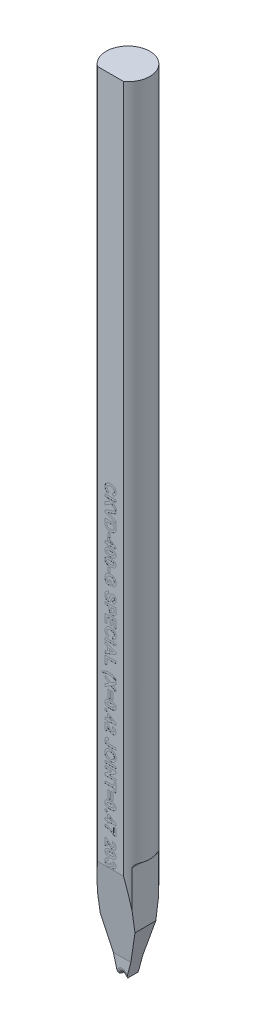
from build123d import *

# Parameters (mm, degrees)
SKETCH_TL_CUTTING_R       = 1.99771
TL_CUTTING_DEPTH          = 72.009
SKETCH_TDF_GRINDING_W     = 4.01542
SKETCH_TDF_GRINDING_H     = 4.01542
TDF_GRINDING_DEPTH        = 73.064400167
SKETCH_ENGRAVING_W        = 0.166666667
SKETCH_ENGRAVING_H        = 0.371794872
SKETCH_ENGRAVING_W_2      = 1
SKETCH_ENGRAVING_H_2      = 0.192307693
SKETCH_ENGRAVING_H_3      = 0.692307692
SKETCH_ENGRAVING_W_3      = 0.192307692
SKETCH_ENGRAVING_H_4      = 0.192307692
SKETCH_ENGRAVING_H_5      = 0.692307693
ENGRAVING_DEPTH           = 0.005
VW_VR_GRINDING_DEPTH      = 2.00771
VW_VR_GRINDING_DEPTH_BACK = 2.00771
ISA_GRINDING_DEPTH        = 2.00771
ISA_GRINDING_DEPTH_BACK   = 2.00771
PRE_FRX_BRX_DEPTH         = 2.00771
PRE_FRX_BRX_DEPTH_BACK    = 2.00771
SKETCH_PRE_FRX_BRX_W      = 1.46796
SKETCH_PRE_FRX_BRX_H      = 1.4986
FR_EDM_R                  = 0.39878
BR_EDM_R                  = 0.20066
FA_BA_GRINDING_DEPTH      = 2.00771
FA_BA_GRINDING_DEPTH_BACK = 2.00771


with BuildPart() as part:
    # sketch_TL_cutting → TL_cutting (new body)
    with BuildSketch(Plane(origin=(0, 0, 0), x_dir=(1, 0, 0), z_dir=(0, 1, 0))):
        Circle(SKETCH_TL_CUTTING_R)
    extrude(amount=TL_CUTTING_DEPTH)

    # sketch_TDF_grinding → TDF_grinding (cut, through all)
    with BuildSketch(Plane(origin=(0, 0, 0), x_dir=(1, 0, 0), z_dir=(0, 1, 0))):
        with Locations((0, -3.60918)):
            Rectangle(SKETCH_TDF_GRINDING_W, SKETCH_TDF_GRINDING_H)
    extrude(amount=TDF_GRINDING_DEPTH, mode=Mode.SUBTRACT)

    # sketch_engraving → engraving (cut)
    # profile 1 of 44: a face of its own
    with BuildSketch(Plane.XY.offset(1.60147)):
        with BuildLine():
            Line((-0.128205128, 38.861360256), (-0.192307692, 38.669052564))
            add(Edge.make_bspline(
                [(-0.192307692, 38.669052564), (-0.204917923, 38.672959052), (-0.229612721, 38.680609184), (-0.2649877, 38.694687804), (-0.297871332, 38.710682008), (-0.328259475, 38.728509875), (-0.356049464, 38.748245258), (-0.381471598, 38.769739244), (-0.404368127, 38.793203424), (-0.424673345, 38.818620624), (-0.442633936, 38.845713711), (-0.457816548, 38.874806053), (-0.470893242, 38.90546117), (-0.481488041, 38.937990557), (-0.489972889, 38.972178151), (-0.495577171, 39.008184413), (-0.499377062, 39.045840896), (-0.499789062, 39.071553283), (-0.5, 39.084717628)],
                knots=[0, 0, 0, 0, 1.126670901, 2.206376047, 3.246533763, 4.245677351, 5.210506282, 6.152793389, 7.083980095, 8.004497442, 8.926231833, 9.854395169, 10.801995143, 11.768203916, 12.771938831, 13.805609698, 14.87650608, 16, 16, 16, 16], degree=3))
            add(Edge.make_bspline(
                [(-0.5, 39.084717628), (-0.499663994, 39.100966309), (-0.499003061, 39.132927949), (-0.492350465, 39.179669052), (-0.481969511, 39.224210328), (-0.467601869, 39.266619613), (-0.448555271, 39.306598786), (-0.42571373, 39.344523108), (-0.398318662, 39.379959391), (-0.367249987, 39.413100716), (-0.332452821, 39.443229196), (-0.294134751, 39.469222297), (-0.253074131, 39.491760491), (-0.208709772, 39.509686594), (-0.161353037, 39.523771791), (-0.110975156, 39.533618328), (-0.057578507, 39.539784942), (-0.020984357, 39.540487083), (-0.002203526, 39.540847436)],
                knots=[0, 0, 0, 0, 1.025134988, 2.016471176, 2.973446247, 3.909197306, 4.836872559, 5.763618465, 6.698581235, 7.658772073, 8.627106982, 9.597494692, 10.576422683, 11.578339294, 12.6118974, 13.690673505, 14.814808564, 16, 16, 16, 16], degree=3))
            add(Edge.make_bspline(
                [(-0.002203526, 39.540847436), (0.017576475, 39.5404792), (0.056163648, 39.539760839), (0.112313555, 39.533712878), (0.165084042, 39.523666768), (0.214577853, 39.510090058), (0.260470573, 39.491879249), (0.303160692, 39.470023909), (0.342311169, 39.443906152), (0.377833814, 39.413981091), (0.409480853, 39.380847852), (0.437377469, 39.345143428), (0.460593243, 39.306641041), (0.479896446, 39.265817336), (0.494630503, 39.222373397), (0.505304611, 39.176426602), (0.511505561, 39.127956054), (0.512376199, 39.09481808), (0.512820513, 39.077906731)],
                knots=[0, 0, 0, 0, 1.212773307, 2.365899439, 3.458117515, 4.504331001, 5.50806732, 6.480562534, 7.440239902, 8.387651817, 9.323121479, 10.245404239, 11.160468186, 12.07454208, 13.009500751, 13.96802424, 14.963018902, 16, 16, 16, 16], degree=3))
            add(Edge.make_bspline(
                [(0.512820513, 39.077906731), (0.512448361, 39.063137276), (0.511718707, 39.034179796), (0.506761415, 38.991774506), (0.498061698, 38.951586158), (0.486319015, 38.913397521), (0.470821797, 38.877425987), (0.451884357, 38.843607111), (0.429606892, 38.811824651), (0.412205553, 38.792675065), (0.403445513, 38.783034936)],
                knots=[0, 0, 0, 0, 1.098510076, 2.153775193, 3.169777012, 4.153122333, 5.120892526, 6.076995459, 7.031936742, 8, 8, 8, 8], degree=3))
            add(Edge.make_bspline(
                [(0.403445513, 38.783034936), (0.39787141, 38.777447644), (0.386592274, 38.766141818), (0.367549896, 38.751045368), (0.347050772, 38.736732058), (0.324745215, 38.723429068), (0.30046466, 38.711556849), (0.274581981, 38.700544097), (0.246997406, 38.690405069), (0.227800247, 38.684766604), (0.217948718, 38.681873077)],
                knots=[0, 0, 0, 0, 0.885292881, 1.791380647, 2.722937556, 3.69093542, 4.703306561, 5.754477758, 6.847650944, 8, 8, 8, 8], degree=3))
            Line((0.217948718, 38.681873077), (0.179487179, 38.874180769))
            add(Edge.make_bspline(
                [(0.179487179, 38.874180769), (0.1857949, 38.875815288), (0.198219456, 38.879034861), (0.21607256, 38.88554955), (0.233014714, 38.893021208), (0.248625569, 38.9022861), (0.263619506, 38.912112074), (0.277222328, 38.923774773), (0.290109132, 38.936279754), (0.301694454, 38.950168861), (0.312145605, 38.965043589), (0.321339918, 38.980753983), (0.329014435, 38.997338478), (0.335156827, 39.014671754), (0.340319842, 39.032695702), (0.34350638, 39.051582147), (0.345953545, 39.071165752), (0.3460861, 39.084508875), (0.346153846, 39.091328205)],
                knots=[0, 0, 0, 0, 1.051114734, 2.070420253, 3.064047898, 4.034553068, 4.997066449, 5.953344811, 6.921213386, 7.892675544, 8.867420182, 9.852654213, 10.826683617, 11.811917648, 12.818610352, 13.848120519, 14.900229319, 16, 16, 16, 16], degree=3))
            add(Edge.make_bspline(
                [(0.346153846, 39.091328205), (0.345958725, 39.100692256), (0.345576529, 39.11903423), (0.341532101, 39.14576448), (0.335695112, 39.171205692), (0.326982094, 39.19526706), (0.315677399, 39.217881698), (0.302244603, 39.239378905), (0.286035184, 39.259210806), (0.26758257, 39.277849764), (0.246135655, 39.294557721), (0.221779967, 39.309260652), (0.194212535, 39.321454121), (0.163711493, 39.331354409), (0.130202077, 39.339146736), (0.093641969, 39.344711162), (0.054005962, 39.347788434), (0.026581025, 39.348283903), (0.012419872, 39.348539744)],
                knots=[0, 0, 0, 0, 0.93816214, 1.837638998, 2.704791736, 3.551915875, 4.396257554, 5.235807848, 6.087970119, 6.959042444, 7.860386085, 8.80649345, 9.804409709, 10.875695391, 12.017327537, 13.250155505, 14.580089023, 16, 16, 16, 16], degree=3))
            add(Edge.make_bspline(
                [(0.012419872, 39.348539744), (-0.002609028, 39.348286423), (-0.031567402, 39.347798312), (-0.073337178, 39.344721685), (-0.111754322, 39.339121705), (-0.14688701, 39.331432849), (-0.178713725, 39.321482973), (-0.207179389, 39.309309106), (-0.23231734, 39.294836701), (-0.254110839, 39.278088275), (-0.272831387, 39.259487256), (-0.288926796, 39.239537439), (-0.302688307, 39.218356524), (-0.314010391, 39.195817053), (-0.322575422, 39.171833298), (-0.328786932, 39.146602371), (-0.332735688, 39.120031695), (-0.333131326, 39.101825799), (-0.333333333, 39.092530128)],
                knots=[0, 0, 0, 0, 1.475208372, 2.842499301, 4.107722225, 5.282836115, 6.369007568, 7.375918121, 8.315702116, 9.208439171, 10.065831443, 10.90006451, 11.71996243, 12.54067204, 13.369972975, 14.214060185, 15.088124569, 16, 16, 16, 16], degree=3))
            add(Edge.make_bspline(
                [(-0.333333333, 39.092530128), (-0.333161634, 39.085647953), (-0.332824013, 39.072115176), (-0.330681155, 39.052112689), (-0.326591822, 39.03291438), (-0.321184418, 39.014426281), (-0.314399721, 38.996576559), (-0.305696319, 38.97963748), (-0.295693052, 38.963275777), (-0.283969989, 38.94783094), (-0.270808612, 38.933096156), (-0.255597341, 38.919657159), (-0.238701667, 38.907191373), (-0.220008678, 38.895856947), (-0.199678377, 38.88527516), (-0.177394008, 38.876272121), (-0.153515697, 38.867884984), (-0.136789345, 38.863573153), (-0.128205128, 38.861360256)],
                knots=[0, 0, 0, 0, 0.980177776, 1.927374078, 2.859849964, 3.771585772, 4.668674471, 5.574490016, 6.479656464, 7.396337719, 8.332153134, 9.288470092, 10.28125149, 11.318486971, 12.398724812, 13.541284404, 14.738150009, 16, 16, 16, 16], degree=3))
        make_face()
    # profile 2 of 44: a face of its own
    with BuildSketch(Plane.XY.offset(1.60147)):
        Polygon((-0.5, 38.502385897), (0.5, 38.502385897), (0.5, 38.310078205), (0.052283654, 38.310078205), (0.5, 37.888403526), (0.5, 37.624180769), (0.11338141, 38.003988462), (-0.5, 37.611360256), (-0.5, 37.867570192), (-0.035456731, 38.149821795), (-0.198517628, 38.310078205), (-0.5, 38.310078205), align=None)
    # profile 3 of 44: a face of its own
    with BuildSketch(Plane.XY.offset(1.60147)):
        Polygon((-0.5, 37.235158333), (0.5, 37.60495), (0.5, 37.401825), (-0.243589744, 37.137001282), (0.5, 36.873179167), (0.5, 36.669052564), (-0.5, 37.037441987), align=None)
    # profile 4 of 44: a face of its own
    with BuildSketch(Plane.XY.offset(1.60147)):
        with BuildLine():
            Line((0.5, 36.579308974), (0.5, 36.212522115))
            add(Edge.make_bspline(
                [(0.5, 36.212522115), (0.500005193, 36.202504571), (0.500015306, 36.182998084), (0.498840892, 36.154689066), (0.497659587, 36.128216494), (0.495294873, 36.103656352), (0.492816233, 36.080923432), (0.489678088, 36.059976942), (0.485656212, 36.040949202), (0.482484481, 36.028950319), (0.480969551, 36.023219231)],
                knots=[0, 0, 0, 0, 1.259756885, 2.453039283, 3.563158368, 4.591894114, 5.55549294, 6.43918076, 7.254497783, 8, 8, 8, 8], degree=3))
            add(Edge.make_bspline(
                [(0.480969551, 36.023219231), (0.478637325, 36.016050254), (0.474014881, 36.001841431), (0.465827813, 35.980988378), (0.455960096, 35.961154479), (0.445111978, 35.941879819), (0.432903728, 35.923607553), (0.419595761, 35.905892873), (0.404753223, 35.889259803), (0.383633179, 35.86772514), (0.35420815, 35.843300255), (0.315375005, 35.81746972), (0.272594656, 35.795732014), (0.234409605, 35.780540641), (0.20183843, 35.770496542), (0.175754603, 35.763928141), (0.148301213, 35.758256468), (0.119383738, 35.754006292), (0.08913491, 35.750344906), (0.057465542, 35.747717238), (0.024383276, 35.74641625), (0.001870575, 35.746124494), (-0.009615385, 35.745975641)],
                knots=[0, 0, 0, 0, 0.745431882, 1.477436776, 2.212739876, 2.934276521, 3.663147754, 4.384200836, 5.123377481, 5.865761747, 7.365547505, 8.894711587, 10.468722596, 12.101948761, 12.951987285, 13.837595333, 14.760899389, 15.722756883, 16.726861385, 17.773652936, 18.864119771, 20, 20, 20, 20], degree=3))
            add(Edge.make_bspline(
                [(-0.009615385, 35.745975641), (-0.0294616, 35.746367046), (-0.067834928, 35.74712384), (-0.123301552, 35.752721211), (-0.17465514, 35.762016648), (-0.206804138, 35.771727075), (-0.222355769, 35.776424359)],
                knots=[0, 0, 0, 0, 1.103491527, 2.133638164, 3.0971734, 4, 4, 4, 4], degree=3))
            add(Edge.make_bspline(
                [(-0.222355769, 35.776424359), (-0.231274521, 35.779598003), (-0.248819098, 35.785841057), (-0.274127236, 35.796765932), (-0.298211673, 35.808570337), (-0.321053432, 35.821352184), (-0.342549771, 35.835176052), (-0.362636394, 35.850093645), (-0.381577746, 35.865873731), (-0.393236239, 35.87730549), (-0.399038462, 35.882994872)],
                knots=[0, 0, 0, 0, 1.090884612, 2.145940218, 3.175104604, 4.181306866, 5.161203701, 6.118658341, 7.063689906, 8, 8, 8, 8], degree=3))
            add(Edge.make_bspline(
                [(-0.399038462, 35.882994872), (-0.407300305, 35.892281145), (-0.424264154, 35.911348431), (-0.445652736, 35.94469995), (-0.464086504, 35.982575276), (-0.473760833, 36.009889168), (-0.478766026, 36.024020513)],
                knots=[0, 0, 0, 0, 0.912008655, 1.872605891, 2.89935344, 4, 4, 4, 4], degree=3))
            add(Edge.make_bspline(
                [(-0.478766026, 36.024020513), (-0.4805228, 36.029740486), (-0.484168894, 36.041611996), (-0.488062998, 36.060435444), (-0.492165475, 36.080529947), (-0.49463687, 36.102127223), (-0.497243066, 36.125003081), (-0.498706299, 36.149339822), (-0.49974511, 36.175053081), (-0.499913777, 36.192689175), (-0.5, 36.201704808)],
                knots=[0, 0, 0, 0, 0.799129865, 1.658552685, 2.566799617, 3.538529252, 4.561352959, 5.643373779, 6.795284424, 8, 8, 8, 8], degree=3))
            Line((-0.5, 36.201704808), (-0.5, 36.579308974))
            Line((-0.5, 36.579308974), (0.5, 36.579308974))
        make_face()
        with BuildLine():
            Line((0.333333333, 36.387001282), (-0.333333333, 36.387001282))
            Line((-0.333333333, 36.387001282), (-0.333333333, 36.228748077))
            add(Edge.make_bspline(
                [(-0.333333333, 36.228748077), (-0.333276671, 36.22160336), (-0.333167574, 36.207847049), (-0.332847006, 36.187941316), (-0.331979167, 36.169648115), (-0.331080228, 36.152871614), (-0.329595022, 36.13765549), (-0.328134266, 36.123933535), (-0.326090699, 36.111782132), (-0.324477534, 36.104277127), (-0.323717949, 36.100743269)],
                knots=[0, 0, 0, 0, 1.333384787, 2.567275092, 3.714769766, 4.750907381, 5.701951617, 6.567520054, 7.325492842, 8, 8, 8, 8], degree=3))
            add(Edge.make_bspline(
                [(-0.323717949, 36.100743269), (-0.321509316, 36.092466575), (-0.317207482, 36.076345757), (-0.307617456, 36.053710499), (-0.296048139, 36.033228507), (-0.282136533, 36.01455677), (-0.26455548, 35.99772967), (-0.242070693, 35.983365683), (-0.215254411, 35.970072192), (-0.189584523, 35.960968806), (-0.16665678, 35.954434413), (-0.147412959, 35.950011165), (-0.126593091, 35.946515591), (-0.104279343, 35.943508942), (-0.080500412, 35.941079499), (-0.055170426, 35.939567784), (-0.028320392, 35.938536029), (-0.009883527, 35.938369161), (-0.000400641, 35.938283333)],
                knots=[0, 0, 0, 0, 1.038686998, 2.023088296, 2.974059649, 3.888265163, 4.839857954, 5.909819677, 7.113156087, 8.466843969, 9.20827164, 10.006482943, 10.861893492, 11.769681931, 12.739021491, 13.762258324, 14.849031541, 16, 16, 16, 16], degree=3))
            add(Edge.make_bspline(
                [(-0.000400641, 35.938283333), (0.009082275, 35.9383685), (0.027452469, 35.938533485), (0.054102292, 35.939563664), (0.079033415, 35.941066863), (0.102276578, 35.943513691), (0.123864169, 35.946473456), (0.143813574, 35.950010891), (0.161996804, 35.954404423), (0.183589283, 35.960957511), (0.207947697, 35.970794996), (0.23429421, 35.984621199), (0.2571147, 36.000886402), (0.276689574, 36.019241558), (0.29287817, 36.040328569), (0.306422028, 36.063699371), (0.316938162, 36.089830279), (0.321416742, 36.108419318), (0.323717949, 36.117970833)],
                knots=[0, 0, 0, 0, 1.118059345, 2.165891593, 3.144157881, 4.062285166, 4.920717571, 5.712910489, 6.449981617, 7.12489426, 8.371943983, 9.541298068, 10.624898781, 11.666293176, 12.69306237, 13.747704633, 14.842713931, 16, 16, 16, 16], degree=3))
            add(Edge.make_bspline(
                [(0.323717949, 36.117970833), (0.324486218, 36.122105143), (0.326177652, 36.131207311), (0.328151987, 36.146311571), (0.329628909, 36.164098179), (0.331099472, 36.184527116), (0.331977905, 36.207577064), (0.332859431, 36.233282571), (0.333166326, 36.261666851), (0.333276065, 36.281499207), (0.333333333, 36.291849038)],
                knots=[0, 0, 0, 0, 0.578739524, 1.274162912, 2.095457587, 3.035141998, 4.093102578, 5.270121571, 6.575369351, 8, 8, 8, 8], degree=3))
            Line((0.333333333, 36.291849038), (0.333333333, 36.387001282))
        make_face(mode=Mode.SUBTRACT)
    # profile 5 of 44: a face of its own
    with BuildSketch(Plane.XY.offset(1.60147)):
        with Locations((-0.147435898, 35.419052564)):
            Rectangle(SKETCH_ENGRAVING_W, SKETCH_ENGRAVING_H)
    # profile 6 of 44: a face of its own
    with BuildSketch(Plane.XY.offset(1.60147)):
        Polygon((-0.5, 34.797257692), (-0.294871795, 34.797257692), (-0.294871795, 35.19469359), (-0.12880609, 35.19469359), (0.487179487, 34.771816987), (0.487179487, 34.60495), (-0.128205128, 34.60495), (-0.128205128, 34.476744872), (-0.294871795, 34.476744872), (-0.294871795, 34.60495), (-0.5, 34.60495), align=None)
        Polygon((-0.128205128, 34.797257692), (0.204727564, 34.797257692), (-0.128205128, 35.026023718), align=None, mode=Mode.SUBTRACT)
    # profile 7 of 44: a face of its own
    with BuildSketch(Plane.XY.offset(1.60147)):
        with BuildLine():
            add(Edge.make_bspline(
                [(0.5, 34.072898718), (0.49971384, 34.060994998), (0.499156721, 34.037819821), (0.494192381, 34.004057508), (0.486315205, 33.972304925), (0.474936732, 33.942555943), (0.460535804, 33.914659267), (0.442472771, 33.889007415), (0.421624591, 33.86500643), (0.405435577, 33.851150797), (0.397235577, 33.844132692)],
                knots=[0, 0, 0, 0, 1.098626248, 2.138899374, 3.143835643, 4.113754749, 5.073488057, 6.034745239, 7.004566348, 8, 8, 8, 8], degree=3))
            add(Edge.make_bspline(
                [(0.397235577, 33.844132692), (0.392013767, 33.840117993), (0.381356969, 33.831924695), (0.364136726, 33.82089029), (0.345869985, 33.810281685), (0.326116385, 33.801023442), (0.305221356, 33.792150078), (0.283126793, 33.783959313), (0.259707844, 33.77672695), (0.235071142, 33.770422124), (0.209179241, 33.764528627), (0.181968999, 33.759591398), (0.15350924, 33.755365972), (0.123831018, 33.752070738), (0.092992495, 33.749116339), (0.060842825, 33.747499757), (0.027454838, 33.746175267), (0.004742429, 33.746042949), (-0.006810897, 33.745975641)],
                knots=[0, 0, 0, 0, 0.746775751, 1.524038446, 2.317840886, 3.141016509, 3.996283186, 4.892488336, 5.812382473, 6.774967264, 7.776368117, 8.823659909, 9.910833035, 11.039122168, 12.210293276, 13.424012874, 14.68964937, 16, 16, 16, 16], degree=3))
            add(Edge.make_bspline(
                [(-0.006810897, 33.745975641), (-0.01836425, 33.746041934), (-0.041009977, 33.746171876), (-0.074330982, 33.747504693), (-0.106413621, 33.749117781), (-0.13725379, 33.752063853), (-0.166926114, 33.755390728), (-0.195353975, 33.759496272), (-0.22243919, 33.764814764), (-0.248289812, 33.770621418), (-0.27303117, 33.776886077), (-0.296407841, 33.7844399), (-0.318777777, 33.792300303), (-0.339699687, 33.801379898), (-0.359477735, 33.810970372), (-0.377930928, 33.821421112), (-0.395257891, 33.832578726), (-0.40597091, 33.840851289), (-0.411258013, 33.844933974)],
                knots=[0, 0, 0, 0, 1.308411734, 2.564617834, 3.776541518, 4.94597967, 6.0725993, 7.15816376, 8.197872509, 9.197791611, 10.158952087, 11.086962723, 11.979249638, 12.843171697, 13.668427753, 14.467630577, 15.243743175, 16, 16, 16, 16], degree=3))
            add(Edge.make_bspline(
                [(-0.411258013, 33.844933974), (-0.419387722, 33.851887875), (-0.435436162, 33.865615209), (-0.456111536, 33.889350465), (-0.473801555, 33.9149609), (-0.487914093, 33.942807064), (-0.499368982, 33.972411236), (-0.506993451, 34.004215546), (-0.511967929, 34.037885616), (-0.512532265, 34.061061213), (-0.512820513, 34.072898718)],
                knots=[0, 0, 0, 0, 0.991667276, 1.957599061, 2.911530233, 3.873218945, 4.847995157, 5.850445929, 6.902062539, 8, 8, 8, 8], degree=3))
            add(Edge.make_bspline(
                [(-0.512820513, 34.072898718), (-0.512476011, 34.084871133), (-0.511800941, 34.108331702), (-0.506449472, 34.142585149), (-0.497876451, 34.175144622), (-0.485636462, 34.205893234), (-0.469774335, 34.234786989), (-0.45076002, 34.262051616), (-0.427732542, 34.287093948), (-0.40629523, 34.306699361), (-0.386925042, 34.321042741), (-0.37086259, 34.331159036), (-0.353675124, 34.340935358), (-0.33482528, 34.349373499), (-0.314870578, 34.357698475), (-0.293380967, 34.365071787), (-0.270541238, 34.371576959), (-0.246455682, 34.377684901), (-0.220958398, 34.382778025), (-0.194124629, 34.387462952), (-0.165840258, 34.391154927), (-0.136262825, 34.394428243), (-0.105322509, 34.396732844), (-0.073069943, 34.398604475), (-0.039401887, 34.399542969), (-0.01649349, 34.399727608), (-0.004807692, 34.399821795)],
                knots=[0, 0, 0, 0, 1.257818097, 2.464759732, 3.634271214, 4.790227596, 5.933394726, 7.09190477, 8.274482889, 9.50191983, 10.139172818, 10.805000628, 11.49619854, 12.215266328, 12.973768034, 13.768328009, 14.601232062, 15.469317089, 16.379095881, 17.333267023, 18.331755967, 19.376479622, 20.460535752, 21.592206075, 22.771760786, 24, 24, 24, 24], degree=3))
            add(Edge.make_bspline(
                [(-0.004807692, 34.399821795), (0.006678925, 34.399756), (0.02919122, 34.399627052), (0.062378132, 34.398284948), (0.094328674, 34.396691634), (0.12509981, 34.39371902), (0.154640959, 34.390419515), (0.183004063, 34.386306894), (0.209982531, 34.380888814), (0.235876189, 34.375539743), (0.260431507, 34.368799782), (0.2837906, 34.361374475), (0.306110518, 34.353540136), (0.326924245, 34.344367854), (0.346659803, 34.334832898), (0.365109758, 34.324374838), (0.382437536, 34.313219066), (0.39315045, 34.304946265), (0.3984375, 34.300863462)],
                knots=[0, 0, 0, 0, 1.304443357, 2.556541329, 3.771813033, 4.936929721, 6.066661712, 7.147723817, 8.190304831, 9.191350322, 10.149780912, 11.080355239, 11.975107155, 12.834450748, 13.66198663, 14.463397305, 15.241653965, 16, 16, 16, 16], degree=3))
            add(Edge.make_bspline(
                [(0.3984375, 34.300863462), (0.406566428, 34.293909179), (0.422613323, 34.280181089), (0.443299998, 34.256451361), (0.460913987, 34.230869209), (0.475197493, 34.203104301), (0.486497465, 34.173432107), (0.494183265, 34.141586121), (0.499144648, 34.107910686), (0.499710816, 34.084735839), (0.5, 34.072898718)],
                knots=[0, 0, 0, 0, 0.991631672, 1.957528776, 2.911425699, 3.867574088, 4.848108326, 5.850523106, 6.902101959, 8, 8, 8, 8], degree=3))
        make_face()
        with BuildLine():
            add(Edge.make_bspline(
                [(0.333333333, 34.072898718), (0.333068079, 34.079066684), (0.332548986, 34.091137158), (0.328316127, 34.108692094), (0.321759633, 34.125273165), (0.312130705, 34.140831206), (0.299093083, 34.15523978), (0.281476094, 34.167447658), (0.259881539, 34.178001162), (0.243736, 34.183280771), (0.235176282, 34.186079808)],
                knots=[0, 0, 0, 0, 0.909107913, 1.77908945, 2.650019014, 3.530482969, 4.465025013, 5.495890128, 6.672421267, 8, 8, 8, 8], degree=3))
            add(Edge.make_bspline(
                [(0.235176282, 34.186079808), (0.228718042, 34.187827997), (0.214837576, 34.191585317), (0.192206647, 34.19584972), (0.166522939, 34.199366485), (0.137792419, 34.202336038), (0.105999886, 34.204752628), (0.071125109, 34.206240848), (0.033192525, 34.207269478), (0.006878451, 34.207430391), (-0.006810897, 34.207514103)],
                knots=[0, 0, 0, 0, 0.658986521, 1.416336438, 2.266694271, 3.212608458, 4.261595115, 5.407496572, 6.651304179, 8, 8, 8, 8], degree=3))
            add(Edge.make_bspline(
                [(-0.006810897, 34.207514103), (-0.020433943, 34.207523117), (-0.046549094, 34.207540397), (-0.084006477, 34.206366163), (-0.118154033, 34.20519872), (-0.148991056, 34.202829061), (-0.176626244, 34.200490892), (-0.200847568, 34.196953343), (-0.221857789, 34.193400608), (-0.244486895, 34.187367153), (-0.268257705, 34.179051394), (-0.292448985, 34.167822977), (-0.311537375, 34.155157058), (-0.325415776, 34.140625587), (-0.334597404, 34.124880329), (-0.341538269, 34.108576395), (-0.345246665, 34.091024555), (-0.345848983, 34.078990013), (-0.346153846, 34.072898718)],
                knots=[0, 0, 0, 0, 1.613038927, 3.092168624, 4.43749063, 5.658264602, 6.75425577, 7.720394221, 8.556328411, 9.275513998, 10.490872946, 11.534172084, 12.42681833, 13.187531851, 13.88996177, 14.574222125, 15.278341114, 16, 16, 16, 16], degree=3))
            add(Edge.make_bspline(
                [(-0.346153846, 34.072898718), (-0.345874419, 34.06680088), (-0.345321688, 34.054738799), (-0.341225408, 34.037206833), (-0.334465655, 34.020649336), (-0.325029126, 34.004986493), (-0.311901617, 33.99056441), (-0.294300445, 33.978347614), (-0.272700888, 33.96779693), (-0.25655611, 33.962516893), (-0.247996795, 33.959717628)],
                knots=[0, 0, 0, 0, 0.899391665, 1.779078861, 2.640979247, 3.529945348, 4.464599804, 5.495588918, 6.672261578, 8, 8, 8, 8], degree=3))
            add(Edge.make_bspline(
                [(-0.247996795, 33.959717628), (-0.241538043, 33.957971968), (-0.227719754, 33.954237186), (-0.205229709, 33.949942396), (-0.179679092, 33.94641611), (-0.151079269, 33.943474791), (-0.11935541, 33.941034431), (-0.084546407, 33.939558845), (-0.046680798, 33.938529247), (-0.020433482, 33.938367356), (-0.006810897, 33.938283333)],
                knots=[0, 0, 0, 0, 0.66114423, 1.414496391, 2.261103113, 3.210114492, 4.255954433, 5.405607896, 6.653488082, 8, 8, 8, 8], degree=3))
            add(Edge.make_bspline(
                [(-0.006810897, 33.938283333), (0.006810741, 33.938397109), (0.032921137, 33.938615199), (0.070464093, 33.939242091), (0.104645163, 33.940997006), (0.13553417, 33.942753226), (0.163028833, 33.945718631), (0.187277888, 33.948661537), (0.208178651, 33.952733667), (0.23096624, 33.958325697), (0.254848985, 33.96666368), (0.278913284, 33.97823584), (0.298191428, 33.99067291), (0.312146257, 34.005179879), (0.321683592, 34.020898044), (0.328364426, 34.037350374), (0.332523972, 34.054799531), (0.333060584, 34.06679941), (0.333333333, 34.072898718)],
                knots=[0, 0, 0, 0, 1.611458614, 3.088895909, 4.441089836, 5.660086535, 6.747875232, 7.711965119, 8.548505902, 9.26500436, 10.486583113, 11.532259092, 12.419544583, 13.184925779, 13.890764661, 14.581638641, 15.279074115, 16, 16, 16, 16], degree=3))
        make_face(mode=Mode.SUBTRACT)
    # profile 8 of 44: a face of its own
    with BuildSketch(Plane.XY.offset(1.60147)):
        with BuildLine():
            add(Edge.make_bspline(
                [(0.5, 33.303667949), (0.49971384, 33.291764229), (0.499156721, 33.268589051), (0.494192381, 33.234826739), (0.486315205, 33.203074156), (0.474936732, 33.173325173), (0.460535804, 33.145428497), (0.442472771, 33.119776646), (0.421624591, 33.095775661), (0.405435577, 33.081920028), (0.397235577, 33.074901923)],
                knots=[0, 0, 0, 0, 1.098626248, 2.138899374, 3.143835643, 4.113754749, 5.073488057, 6.034745239, 7.004566348, 8, 8, 8, 8], degree=3))
            add(Edge.make_bspline(
                [(0.397235577, 33.074901923), (0.392013767, 33.070887224), (0.381356969, 33.062693926), (0.364136726, 33.05165952), (0.345869985, 33.041050915), (0.326116385, 33.031792673), (0.305221356, 33.022919309), (0.283126793, 33.014728544), (0.259707844, 33.00749618), (0.235071142, 33.001191354), (0.209179241, 32.995297858), (0.181968999, 32.990360628), (0.15350924, 32.986135203), (0.123831018, 32.982839969), (0.092992495, 32.97988557), (0.060842825, 32.978268988), (0.027454838, 32.976944498), (0.004742429, 32.976812179), (-0.006810897, 32.976744872)],
                knots=[0, 0, 0, 0, 0.746775751, 1.524038446, 2.317840886, 3.141016509, 3.996283186, 4.892488336, 5.812382473, 6.774967264, 7.776368117, 8.823659909, 9.910833035, 11.039122168, 12.210293276, 13.424012874, 14.68964937, 16, 16, 16, 16], degree=3))
            add(Edge.make_bspline(
                [(-0.006810897, 32.976744872), (-0.01836425, 32.976811165), (-0.041009977, 32.976941107), (-0.074330982, 32.978273924), (-0.106413621, 32.979887012), (-0.13725379, 32.982833084), (-0.166926114, 32.986159959), (-0.195353975, 32.990265503), (-0.22243919, 32.995583995), (-0.248289812, 33.001390649), (-0.27303117, 33.007655308), (-0.296407841, 33.015209131), (-0.318777777, 33.023069533), (-0.339699687, 33.032149129), (-0.359477735, 33.041739602), (-0.377930928, 33.052190342), (-0.395257891, 33.063347957), (-0.40597091, 33.07162052), (-0.411258013, 33.075703205)],
                knots=[0, 0, 0, 0, 1.308411734, 2.564617834, 3.776541518, 4.94597967, 6.0725993, 7.15816376, 8.197872509, 9.197791611, 10.158952087, 11.086962723, 11.979249638, 12.843171697, 13.668427753, 14.467630577, 15.243743175, 16, 16, 16, 16], degree=3))
            add(Edge.make_bspline(
                [(-0.411258013, 33.075703205), (-0.419387722, 33.082657105), (-0.435436162, 33.09638444), (-0.456111536, 33.120119695), (-0.473801555, 33.145730131), (-0.487914093, 33.173576295), (-0.499368982, 33.203180467), (-0.506993451, 33.234984777), (-0.511967929, 33.268654847), (-0.512532265, 33.291830444), (-0.512820513, 33.303667949)],
                knots=[0, 0, 0, 0, 0.991667276, 1.957599061, 2.911530233, 3.873218945, 4.847995157, 5.850445929, 6.902062539, 8, 8, 8, 8], degree=3))
            add(Edge.make_bspline(
                [(-0.512820513, 33.303667949), (-0.512476011, 33.315640364), (-0.511800941, 33.339100933), (-0.506449472, 33.373354379), (-0.497876451, 33.405913853), (-0.485636462, 33.436662465), (-0.469774335, 33.46555622), (-0.45076002, 33.492820847), (-0.427732542, 33.517863179), (-0.40629523, 33.537468592), (-0.386925042, 33.551811971), (-0.37086259, 33.561928267), (-0.353675124, 33.571704589), (-0.33482528, 33.58014273), (-0.314870578, 33.588467706), (-0.293380967, 33.595841018), (-0.270541238, 33.60234619), (-0.246455682, 33.608454132), (-0.220958398, 33.613547256), (-0.194124629, 33.618232183), (-0.165840258, 33.621924157), (-0.136262825, 33.625197473), (-0.105322509, 33.627502075), (-0.073069943, 33.629373706), (-0.039401887, 33.6303122), (-0.01649349, 33.630496839), (-0.004807692, 33.630591026)],
                knots=[0, 0, 0, 0, 1.257818097, 2.464759732, 3.634271214, 4.790227596, 5.933394726, 7.09190477, 8.274482889, 9.50191983, 10.139172818, 10.805000628, 11.49619854, 12.215266328, 12.973768034, 13.768328009, 14.601232062, 15.469317089, 16.379095881, 17.333267023, 18.331755967, 19.376479622, 20.460535752, 21.592206075, 22.771760786, 24, 24, 24, 24], degree=3))
            add(Edge.make_bspline(
                [(-0.004807692, 33.630591026), (0.006678925, 33.630525231), (0.02919122, 33.630396282), (0.062378132, 33.629054179), (0.094328674, 33.627460865), (0.12509981, 33.624488251), (0.154640959, 33.621188746), (0.183004063, 33.617076125), (0.209982531, 33.611658045), (0.235876189, 33.606308974), (0.260431507, 33.599569013), (0.2837906, 33.592143706), (0.306110518, 33.584309367), (0.326924245, 33.575137084), (0.346659803, 33.565602128), (0.365109758, 33.555144069), (0.382437536, 33.543988297), (0.39315045, 33.535715495), (0.3984375, 33.531632692)],
                knots=[0, 0, 0, 0, 1.304443357, 2.556541329, 3.771813033, 4.936929721, 6.066661712, 7.147723817, 8.190304831, 9.191350322, 10.149780912, 11.080355239, 11.975107155, 12.834450748, 13.66198663, 14.463397305, 15.241653965, 16, 16, 16, 16], degree=3))
            add(Edge.make_bspline(
                [(0.3984375, 33.531632692), (0.406566428, 33.52467841), (0.422613323, 33.51095032), (0.443299998, 33.487220592), (0.460913987, 33.461638439), (0.475197493, 33.433873532), (0.486497465, 33.404201338), (0.494183265, 33.372355352), (0.499144648, 33.338679916), (0.499710816, 33.31550507), (0.5, 33.303667949)],
                knots=[0, 0, 0, 0, 0.991631672, 1.957528776, 2.911425699, 3.867574088, 4.848108326, 5.850523106, 6.902101959, 8, 8, 8, 8], degree=3))
        make_face()
        with BuildLine():
            add(Edge.make_bspline(
                [(0.333333333, 33.303667949), (0.333068079, 33.309835915), (0.332548986, 33.321906389), (0.328316127, 33.339461325), (0.321759633, 33.356042396), (0.312130705, 33.371600436), (0.299093083, 33.386009011), (0.281476094, 33.398216888), (0.259881539, 33.408770392), (0.243736, 33.414050001), (0.235176282, 33.416849038)],
                knots=[0, 0, 0, 0, 0.909107913, 1.77908945, 2.650019014, 3.530482969, 4.465025013, 5.495890128, 6.672421267, 8, 8, 8, 8], degree=3))
            add(Edge.make_bspline(
                [(0.235176282, 33.416849038), (0.228718042, 33.418597227), (0.214837576, 33.422354548), (0.192206647, 33.426618951), (0.166522939, 33.430135716), (0.137792419, 33.433105269), (0.105999886, 33.435521859), (0.071125109, 33.437010078), (0.033192525, 33.438038709), (0.006878451, 33.438199622), (-0.006810897, 33.438283333)],
                knots=[0, 0, 0, 0, 0.658986521, 1.416336438, 2.266694271, 3.212608458, 4.261595115, 5.407496572, 6.651304179, 8, 8, 8, 8], degree=3))
            add(Edge.make_bspline(
                [(-0.006810897, 33.438283333), (-0.020433943, 33.438292347), (-0.046549094, 33.438309627), (-0.084006477, 33.437135394), (-0.118154033, 33.435967951), (-0.148991056, 33.433598292), (-0.176626244, 33.431260123), (-0.200847568, 33.427722574), (-0.221857789, 33.424169839), (-0.244486895, 33.418136384), (-0.268257705, 33.409820625), (-0.292448985, 33.398592207), (-0.311537375, 33.385926289), (-0.325415776, 33.371394818), (-0.334597404, 33.35564956), (-0.341538269, 33.339345625), (-0.345246665, 33.321793786), (-0.345848983, 33.309759244), (-0.346153846, 33.303667949)],
                knots=[0, 0, 0, 0, 1.613038927, 3.092168624, 4.43749063, 5.658264602, 6.75425577, 7.720394221, 8.556328411, 9.275513998, 10.490872946, 11.534172084, 12.42681833, 13.187531851, 13.88996177, 14.574222125, 15.278341114, 16, 16, 16, 16], degree=3))
            add(Edge.make_bspline(
                [(-0.346153846, 33.303667949), (-0.345874419, 33.297570111), (-0.345321688, 33.28550803), (-0.341225408, 33.267976063), (-0.334465655, 33.251418567), (-0.325029126, 33.235755723), (-0.311901617, 33.221333641), (-0.294300445, 33.209116845), (-0.272700888, 33.198566161), (-0.25655611, 33.193286123), (-0.247996795, 33.190486859)],
                knots=[0, 0, 0, 0, 0.899391665, 1.779078861, 2.640979247, 3.529945348, 4.464599804, 5.495588918, 6.672261578, 8, 8, 8, 8], degree=3))
            add(Edge.make_bspline(
                [(-0.247996795, 33.190486859), (-0.241538043, 33.188741199), (-0.227719754, 33.185006417), (-0.205229709, 33.180711627), (-0.179679092, 33.17718534), (-0.151079269, 33.174244022), (-0.11935541, 33.171803662), (-0.084546407, 33.170328076), (-0.046680798, 33.169298478), (-0.020433482, 33.169136587), (-0.006810897, 33.169052564)],
                knots=[0, 0, 0, 0, 0.66114423, 1.414496391, 2.261103113, 3.210114492, 4.255954433, 5.405607896, 6.653488082, 8, 8, 8, 8], degree=3))
            add(Edge.make_bspline(
                [(-0.006810897, 33.169052564), (0.006810741, 33.16916634), (0.032921137, 33.16938443), (0.070464093, 33.170011322), (0.104645163, 33.171766237), (0.13553417, 33.173522457), (0.163028833, 33.176487861), (0.187277888, 33.179430768), (0.208178651, 33.183502897), (0.23096624, 33.189094928), (0.254848985, 33.19743291), (0.278913284, 33.209005071), (0.298191428, 33.221442141), (0.312146257, 33.23594911), (0.321683592, 33.251667274), (0.328364426, 33.268119605), (0.332523972, 33.285568762), (0.333060584, 33.297568641), (0.333333333, 33.303667949)],
                knots=[0, 0, 0, 0, 1.611458614, 3.088895909, 4.441089836, 5.660086535, 6.747875232, 7.711965119, 8.548505902, 9.26500436, 10.486583113, 11.532259092, 12.419544583, 13.184925779, 13.890764661, 14.581638641, 15.279074115, 16, 16, 16, 16], degree=3))
        make_face(mode=Mode.SUBTRACT)
    # profile 9 of 44: a face of its own
    with BuildSketch(Plane.XY.offset(1.60147)):
        with Locations((-0.147435898, 32.649821795)):
            Rectangle(SKETCH_ENGRAVING_W, SKETCH_ENGRAVING_H)
    # profile 10 of 44: a face of its own
    with BuildSketch(Plane.XY.offset(1.60147)):
        with BuildLine():
            Line((-0.128205128, 31.899821795), (0.038461538, 31.899821795))
            Line((0.038461538, 31.899821795), (0.038461538, 31.463924359))
            Line((0.038461538, 31.463924359), (-0.36338141, 31.463924359))
            add(Edge.make_bspline(
                [(-0.36338141, 31.463924359), (-0.368321434, 31.469410375), (-0.378419843, 31.4806249), (-0.392661125, 31.498922664), (-0.406257259, 31.519066779), (-0.4194836, 31.540935469), (-0.432233696, 31.564573992), (-0.444685123, 31.589888064), (-0.45671611, 31.616924391), (-0.471787381, 31.655157711), (-0.488186169, 31.70437183), (-0.502445448, 31.764537076), (-0.511191227, 31.825178267), (-0.512277771, 31.865739075), (-0.512820513, 31.885999679)],
                knots=[0, 0, 0, 0, 0.581799769, 1.189316438, 1.825828404, 2.496525428, 3.203088405, 3.942228803, 4.719818701, 5.534979611, 7.181138583, 8.803804008, 10.403462225, 12, 12, 12, 12], degree=3))
            add(Edge.make_bspline(
                [(-0.512820513, 31.885999679), (-0.512629241, 31.898692166), (-0.512252188, 31.923712831), (-0.509233571, 31.960651118), (-0.504017902, 31.996368224), (-0.496780719, 32.030800736), (-0.487836372, 32.064051646), (-0.476607913, 32.096004166), (-0.463065488, 32.126624068), (-0.447986133, 32.156140581), (-0.430657849, 32.183993177), (-0.411724289, 32.210237023), (-0.390891397, 32.234617404), (-0.36853351, 32.257346217), (-0.344060025, 32.277994803), (-0.318106216, 32.297076641), (-0.290219674, 32.314135038), (-0.260879177, 32.329461559), (-0.230317098, 32.343090942), (-0.198781008, 32.354593246), (-0.166726875, 32.364676922), (-0.134042675, 32.372964707), (-0.10062201, 32.379051654), (-0.066619552, 32.383783529), (-0.031822841, 32.386325004), (-0.008417054, 32.386774325), (0.003405449, 32.387001282)],
                knots=[0, 0, 0, 0, 1.124897971, 2.217508473, 3.282174662, 4.322209414, 5.334422951, 6.332119154, 7.320662553, 8.300074908, 9.267468154, 10.225199689, 11.165658754, 12.107290334, 13.047749399, 14.00069605, 14.959944213, 15.942088746, 16.933021067, 17.923599838, 18.915715637, 19.910475908, 20.909926025, 21.925232038, 22.952013513, 24, 24, 24, 24], degree=3))
            add(Edge.make_bspline(
                [(0.003405449, 32.387001282), (0.016165747, 32.386817383), (0.041321811, 32.386454838), (0.078501182, 32.383325194), (0.114594914, 32.378477239), (0.149519517, 32.371082247), (0.183523729, 32.362228796), (0.216299841, 32.350884109), (0.248180515, 32.337930661), (0.278688999, 32.322646543), (0.308028284, 32.305763971), (0.335510174, 32.2865804), (0.361403632, 32.2657608), (0.385591047, 32.243117968), (0.407627145, 32.218279007), (0.428063784, 32.191753308), (0.447146094, 32.16355846), (0.457908016, 32.143381736), (0.463341346, 32.133195192)],
                knots=[0, 0, 0, 0, 1.105132952, 2.178694671, 3.229818344, 4.257558797, 5.269123684, 6.27148554, 7.259679084, 8.247804916, 9.224967877, 10.189258471, 11.147685264, 12.101072275, 13.055511435, 14.02039165, 15.000562851, 16, 16, 16, 16], degree=3))
            add(Edge.make_bspline(
                [(0.463341346, 32.133195192), (0.467347168, 32.125107841), (0.475455657, 32.108737618), (0.485329628, 32.082664525), (0.494054347, 32.055296948), (0.500719187, 32.026315473), (0.506115234, 31.996028993), (0.510216979, 31.964287917), (0.512307439, 31.931033708), (0.512647258, 31.908371284), (0.512820513, 31.896816987)],
                knots=[0, 0, 0, 0, 0.887950456, 1.797368171, 2.741221183, 3.713797788, 4.722103116, 5.768966405, 6.862521341, 8, 8, 8, 8], degree=3))
            add(Edge.make_bspline(
                [(0.512820513, 31.896816987), (0.512598613, 31.881919487), (0.512167059, 31.852946604), (0.508571106, 31.81070631), (0.502373597, 31.770952674), (0.493837942, 31.733630334), (0.482863355, 31.698819697), (0.469371425, 31.666580687), (0.453633675, 31.636715429), (0.435019378, 31.609656485), (0.414494937, 31.584853918), (0.392035387, 31.562372449), (0.367607461, 31.542203031), (0.341334074, 31.524332318), (0.313106625, 31.508900967), (0.283182558, 31.495632952), (0.251334696, 31.484711769), (0.22921692, 31.479433803), (0.217948718, 31.476744872)],
                knots=[0, 0, 0, 0, 1.271135529, 2.472123572, 3.614091059, 4.701890498, 5.736279567, 6.724681829, 7.680621489, 8.611506429, 9.52200816, 10.424540711, 11.318996785, 12.221421405, 13.131851814, 14.060431888, 15.011860567, 16, 16, 16, 16], degree=3))
            Line((0.217948718, 31.476744872), (0.179487179, 31.669052564))
            add(Edge.make_bspline(
                [(0.179487179, 31.669052564), (0.185798707, 31.670955146), (0.198251232, 31.674708905), (0.216108293, 31.682015481), (0.232994438, 31.690333603), (0.248643132, 31.700160597), (0.263649233, 31.710598251), (0.277161531, 31.722868435), (0.290187329, 31.735775453), (0.301701762, 31.750266609), (0.312086782, 31.765705164), (0.321450083, 31.781926632), (0.329043783, 31.799294974), (0.335153652, 31.817567597), (0.340342569, 31.836655002), (0.343533767, 31.85680634), (0.345940549, 31.8777953), (0.346081986, 31.892135325), (0.346153846, 31.899421154)],
                knots=[0, 0, 0, 0, 1.027780279, 2.027791312, 3.006028774, 3.96000864, 4.908113241, 5.852721087, 6.802883308, 7.765918715, 8.733730415, 9.704005314, 10.683351261, 11.68471758, 12.707948499, 13.764514378, 14.864202456, 16, 16, 16, 16], degree=3))
            add(Edge.make_bspline(
                [(0.346153846, 31.899421154), (0.345859633, 31.910448511), (0.34528545, 31.931969337), (0.341538784, 31.963386876), (0.334873123, 31.993026442), (0.325679114, 32.02096554), (0.313877959, 32.047255391), (0.299029501, 32.071540737), (0.282012344, 32.09442627), (0.262039987, 32.115260747), (0.239645267, 32.13415525), (0.214561065, 32.150511822), (0.186868462, 32.164128599), (0.156706511, 32.175281515), (0.124073954, 32.184161616), (0.088855272, 32.190185764), (0.051104495, 32.194121833), (0.02505068, 32.194499093), (0.01161859, 32.19469359)],
                knots=[0, 0, 0, 0, 1.043810997, 2.037086103, 2.989314757, 3.91471467, 4.817033861, 5.710208705, 6.603920097, 7.511448416, 8.435617211, 9.371747005, 10.338444094, 11.350425613, 12.411431869, 13.5347293, 14.729025275, 16, 16, 16, 16], degree=3))
            add(Edge.make_bspline(
                [(0.01161859, 32.19469359), (-0.002813331, 32.194490916), (-0.03086261, 32.194097007), (-0.071503034, 32.190262106), (-0.109371212, 32.183963885), (-0.14440027, 32.174896527), (-0.176807311, 32.163589264), (-0.206438048, 32.149609735), (-0.233109204, 32.132801899), (-0.256980675, 32.113739064), (-0.278169336, 32.092702253), (-0.296147735, 32.069639293), (-0.31184176, 32.045381086), (-0.32420794, 32.019241286), (-0.33413508, 31.991692798), (-0.341078682, 31.962466769), (-0.345395871, 31.931668498), (-0.345897627, 31.910586945), (-0.346153846, 31.899821795)],
                knots=[0, 0, 0, 0, 1.31821493, 2.562027667, 3.72541598, 4.821825939, 5.863743127, 6.857000185, 7.808227391, 8.737146514, 9.643023621, 10.529087527, 11.404035307, 12.277173472, 13.164790074, 14.074766194, 15.016892606, 16, 16, 16, 16], degree=3))
            add(Edge.make_bspline(
                [(-0.346153846, 31.899821795), (-0.345850315, 31.888918504), (-0.34524035, 31.867007617), (-0.340086045, 31.834186537), (-0.332449955, 31.801186283), (-0.321065283, 31.768793933), (-0.307937779, 31.737407225), (-0.292687307, 31.708241024), (-0.276962331, 31.680848447), (-0.264654274, 31.664335969), (-0.258613782, 31.656232051)],
                knots=[0, 0, 0, 0, 0.993779204, 1.997065276, 3.023588959, 4.078879359, 5.123947549, 6.123456565, 7.079038607, 8, 8, 8, 8], degree=3))
            Line((-0.258613782, 31.656232051), (-0.128205128, 31.656232051))
            Line((-0.128205128, 31.656232051), (-0.128205128, 31.899821795))
        make_face()
    # profile 11 of 44: a face of its own
    with BuildSketch(Plane.XY.offset(1.60147)):
        with BuildLine():
            Line((-0.166666667, 30.938283333), (-0.153846154, 30.745975641))
            add(Edge.make_bspline(
                [(-0.153846154, 30.745975641), (-0.161891279, 30.744442992), (-0.177518424, 30.741465918), (-0.199795017, 30.734862009), (-0.220541784, 30.727555841), (-0.239662803, 30.718942964), (-0.25710555, 30.709077896), (-0.273156714, 30.698287618), (-0.28732832, 30.686044862), (-0.299925293, 30.672713176), (-0.310783278, 30.658139999), (-0.320246275, 30.642439399), (-0.328256178, 30.625518131), (-0.334922245, 30.607440819), (-0.339885492, 30.588027406), (-0.343420115, 30.567459762), (-0.345682646, 30.545704761), (-0.345994208, 30.530837096), (-0.346153846, 30.523219231)],
                knots=[0, 0, 0, 0, 1.20477517, 2.340199137, 3.415898527, 4.440826703, 5.422227366, 6.362763262, 7.28278988, 8.172822029, 9.057410505, 9.952475558, 10.866920142, 11.809098, 12.784128911, 13.811833846, 14.878831738, 16, 16, 16, 16], degree=3))
            add(Edge.make_bspline(
                [(-0.346153846, 30.523219231), (-0.346066367, 30.515200933), (-0.345896216, 30.499604929), (-0.343785338, 30.477004596), (-0.340761278, 30.455872259), (-0.335974263, 30.436394522), (-0.330620744, 30.418207658), (-0.323296559, 30.401763353), (-0.314849171, 30.386795499), (-0.305263574, 30.373342657), (-0.294632459, 30.361602348), (-0.28353392, 30.351331341), (-0.272207737, 30.342385972), (-0.260151301, 30.335345334), (-0.247852227, 30.329647439), (-0.234943611, 30.32588153), (-0.221721863, 30.323337435), (-0.212685699, 30.323045702), (-0.208133013, 30.322898718)],
                knots=[0, 0, 0, 0, 1.417779877, 2.757654889, 4.012140507, 5.189587551, 6.302846416, 7.360586765, 8.365575446, 9.33904572, 10.275781718, 11.161696098, 12.012180333, 12.822428111, 13.625933072, 14.403138519, 15.195454004, 16, 16, 16, 16], degree=3))
            add(Edge.make_bspline(
                [(-0.208133013, 30.322898718), (-0.202439146, 30.323192996), (-0.191320796, 30.323767629), (-0.175220679, 30.327537928), (-0.160658688, 30.334342431), (-0.147071392, 30.343578971), (-0.134926522, 30.356543369), (-0.123459543, 30.372947524), (-0.11316916, 30.393407237), (-0.107424402, 30.408575842), (-0.104366987, 30.416648718)],
                knots=[0, 0, 0, 0, 0.906150226, 1.7694295, 2.610923838, 3.450874087, 4.367551936, 5.419872502, 6.626831617, 8, 8, 8, 8], degree=3))
            add(Edge.make_bspline(
                [(-0.104366987, 30.416648718), (-0.103205903, 30.420112905), (-0.100607587, 30.427865194), (-0.096897182, 30.441091154), (-0.092218385, 30.457076556), (-0.087052561, 30.475969979), (-0.081545375, 30.497732885), (-0.074955523, 30.522158532), (-0.068334023, 30.549617832), (-0.063456004, 30.568830895), (-0.060897436, 30.578908333)],
                knots=[0, 0, 0, 0, 0.521824192, 1.167757792, 1.961731518, 2.901193269, 3.965386864, 5.168422915, 6.514810244, 8, 8, 8, 8], degree=3))
            add(Edge.make_bspline(
                [(-0.060897436, 30.578908333), (-0.0576208, 30.592031849), (-0.051299067, 30.617351528), (-0.040053153, 30.653463187), (-0.028879714, 30.686722685), (-0.016755933, 30.716809788), (-0.004503472, 30.744056368), (0.008737874, 30.768021704), (0.022280434, 30.7892059), (0.032402475, 30.801550422), (0.037259615, 30.807474038)],
                knots=[0, 0, 0, 0, 1.293880989, 2.496331788, 3.617634808, 4.64976062, 5.598842568, 6.473791081, 7.267636666, 8, 8, 8, 8], degree=3))
            add(Edge.make_bspline(
                [(0.037259615, 30.807474038), (0.044137694, 30.814820092), (0.057622804, 30.829222711), (0.079781426, 30.848181522), (0.103188466, 30.864112086), (0.127671148, 30.877224684), (0.153370416, 30.887321137), (0.180114252, 30.894477373), (0.207972454, 30.899109148), (0.22694455, 30.899581789), (0.236578526, 30.899821795)],
                knots=[0, 0, 0, 0, 1.064429417, 2.086912298, 3.078678339, 4.055528992, 5.020032834, 5.993708893, 6.981211098, 8, 8, 8, 8], degree=3))
            add(Edge.make_bspline(
                [(0.236578526, 30.899821795), (0.249044725, 30.899354331), (0.273773943, 30.898427024), (0.310123415, 30.88992467), (0.34519423, 30.87667628), (0.373053378, 30.861323891), (0.394102454, 30.846545366), (0.409316468, 30.834318713), (0.423234984, 30.820628899), (0.436363342, 30.805967469), (0.448421192, 30.790088333), (0.459337354, 30.772971959), (0.469762031, 30.754940204), (0.481724432, 30.728627828), (0.494501972, 30.693096959), (0.505216674, 30.646861911), (0.511620444, 30.596516137), (0.512410831, 30.561566875), (0.512820513, 30.543451603)],
                knots=[0, 0, 0, 0, 1.180224575, 2.341213254, 3.519178081, 4.726056898, 5.344182394, 5.956118988, 6.573855441, 7.192564044, 7.82049682, 8.461345463, 9.116141012, 9.79299132, 11.198532007, 12.687823846, 14.283197644, 16, 16, 16, 16], degree=3))
            add(Edge.make_bspline(
                [(0.512820513, 30.543451603), (0.512622915, 30.528618568), (0.512238592, 30.499768634), (0.508327094, 30.457950661), (0.502300976, 30.418942321), (0.493471523, 30.382807475), (0.482080613, 30.349478087), (0.468307987, 30.318889204), (0.4520288, 30.291121205), (0.433078398, 30.266469232), (0.412189308, 30.244505993), (0.389371716, 30.225346757), (0.364914548, 30.208918024), (0.338835479, 30.195113833), (0.311000478, 30.184273434), (0.281444264, 30.17631159), (0.250236407, 30.171045557), (0.228852471, 30.16972561), (0.217948718, 30.169052564)],
                knots=[0, 0, 0, 0, 1.325136797, 2.577362738, 3.74962816, 4.849499017, 5.896771726, 6.892816139, 7.842473141, 8.766187929, 9.665133525, 10.546015357, 11.42313021, 12.293255665, 13.177485873, 14.086514152, 15.024305989, 16, 16, 16, 16], degree=3))
            Line((0.217948718, 30.169052564), (0.205128205, 30.361360256))
            add(Edge.make_bspline(
                [(0.205128205, 30.361360256), (0.211158714, 30.362469181), (0.22291155, 30.364630361), (0.239739753, 30.369337468), (0.255319488, 30.374618235), (0.269550394, 30.380884545), (0.282452554, 30.388102876), (0.29405422, 30.396307056), (0.304442868, 30.405342928), (0.313348905, 30.415591396), (0.321255295, 30.42681557), (0.327770309, 30.439442058), (0.333732615, 30.453080184), (0.338229411, 30.468241156), (0.341791978, 30.48465001), (0.344434282, 30.502311538), (0.34572413, 30.521263752), (0.346007328, 30.534302118), (0.346153846, 30.541047756)],
                knots=[0, 0, 0, 0, 1.150775252, 2.242741279, 3.277646382, 4.23752694, 5.158201782, 6.048759188, 6.901533576, 7.736611693, 8.592238639, 9.472855288, 10.399741491, 11.383322377, 12.435924598, 13.551250831, 14.733094547, 16, 16, 16, 16], degree=3))
            add(Edge.make_bspline(
                [(0.346153846, 30.541047756), (0.346024502, 30.548061384), (0.345772856, 30.561706709), (0.344228543, 30.581591585), (0.34137789, 30.60024509), (0.337667048, 30.617758838), (0.332618703, 30.634109434), (0.326463073, 30.649262373), (0.319216002, 30.663286981), (0.313514257, 30.671838576), (0.310697115, 30.676063782)],
                knots=[0, 0, 0, 0, 1.186678824, 2.308736671, 3.37120409, 4.377216403, 5.334874112, 6.262130804, 7.141346615, 8, 8, 8, 8], degree=3))
            add(Edge.make_bspline(
                [(0.310697115, 30.676063782), (0.30684882, 30.680899176), (0.299395868, 30.690263832), (0.284596838, 30.700342185), (0.267881777, 30.706409376), (0.256061421, 30.707139631), (0.25, 30.707514103)],
                knots=[0, 0, 0, 0, 1.037857257, 2.010007357, 2.979541333, 4, 4, 4, 4], degree=3))
            add(Edge.make_bspline(
                [(0.25, 30.707514103), (0.244335199, 30.707207853), (0.233176443, 30.706604591), (0.217325189, 30.700519912), (0.202637862, 30.691162505), (0.194659513, 30.682419543), (0.190504808, 30.677866667)],
                knots=[0, 0, 0, 0, 0.98538058, 1.941042925, 2.927803204, 4, 4, 4, 4], degree=3))
            add(Edge.make_bspline(
                [(0.190504808, 30.677866667), (0.187808196, 30.674253373), (0.18178239, 30.666179166), (0.17412302, 30.651388818), (0.165827461, 30.633536481), (0.157717635, 30.612215163), (0.149622864, 30.587566566), (0.141170987, 30.559589191), (0.132605635, 30.52826583), (0.124310512, 30.494394901), (0.116156882, 30.460006369), (0.107242663, 30.42719034), (0.098551989, 30.396676152), (0.089442753, 30.36860529), (0.080574939, 30.342833056), (0.071467056, 30.31948464), (0.062596997, 30.298399725), (0.050400038, 30.273812375), (0.033878763, 30.245945088), (0.009862335, 30.216737027), (-0.017133698, 30.190906224), (-0.042589095, 30.172908007), (-0.064481415, 30.160544174), (-0.081932142, 30.15258317), (-0.100320809, 30.145696277), (-0.119667735, 30.140090365), (-0.140000145, 30.136027428), (-0.161162698, 30.13266511), (-0.183331155, 30.13094724), (-0.198448465, 30.130711042), (-0.206129808, 30.130591026)],
                knots=[0, 0, 0, 0, 0.511875881, 1.143829537, 1.88775736, 2.750598373, 3.734912702, 4.837306479, 6.073130119, 7.42648979, 8.801963576, 10.091065733, 11.292408984, 12.408830014, 13.446061236, 14.39066453, 15.257936293, 16.045629259, 17.510392066, 18.929669597, 20.331293837, 21.746891395, 22.460690638, 23.187651344, 23.925159671, 24.69163991, 25.474819891, 26.281170188, 27.126635539, 28, 28, 28, 28], degree=3))
            add(Edge.make_bspline(
                [(-0.206129808, 30.130591026), (-0.213213723, 30.130756052), (-0.227281693, 30.131083777), (-0.248162112, 30.133374014), (-0.268671734, 30.136915808), (-0.288836268, 30.14215888), (-0.308616053, 30.149114346), (-0.328296541, 30.156945664), (-0.347448635, 30.166738225), (-0.366087841, 30.177883722), (-0.384201522, 30.190176864), (-0.400907086, 30.204110438), (-0.416780552, 30.218851766), (-0.430830184, 30.235356877), (-0.444499814, 30.252440113), (-0.456413626, 30.271216399), (-0.467267368, 30.291084954), (-0.476944445, 30.312226878), (-0.485241283, 30.33471221), (-0.492760445, 30.35840588), (-0.498861937, 30.383531414), (-0.504102567, 30.409918353), (-0.508085093, 30.437669127), (-0.510866581, 30.466747372), (-0.512434986, 30.497160174), (-0.512690407, 30.517875604), (-0.512820513, 30.528427564)],
                knots=[0, 0, 0, 0, 0.900523777, 1.788352984, 2.667658312, 3.544829998, 4.433470602, 5.332071549, 6.235671317, 7.16456001, 8.092361829, 9.015217829, 9.927983376, 10.842405559, 11.767913001, 12.707486241, 13.664840466, 14.644960138, 15.660436429, 16.710285012, 17.80361473, 18.945755434, 20.129541241, 21.366238063, 22.658422763, 24, 24, 24, 24], degree=3))
            add(Edge.make_bspline(
                [(-0.512820513, 30.528427564), (-0.512571769, 30.543662968), (-0.512087459, 30.573326661), (-0.507752501, 30.616422681), (-0.501117535, 30.65684389), (-0.491487967, 30.694524505), (-0.47912575, 30.729510517), (-0.463898318, 30.761786188), (-0.445714308, 30.791194634), (-0.4250161, 30.818102877), (-0.401421388, 30.842142223), (-0.37543806, 30.863787857), (-0.346733609, 30.882620694), (-0.315676999, 30.899150711), (-0.28185988, 30.912639571), (-0.245840091, 30.92416756), (-0.207125792, 30.932744343), (-0.180386288, 30.936405071), (-0.166666667, 30.938283333)],
                knots=[0, 0, 0, 0, 1.217919187, 2.371317543, 3.459749122, 4.490553404, 5.476795534, 6.422548752, 7.338285933, 8.236452553, 9.131296239, 10.026155855, 10.935394819, 11.871650654, 12.834387429, 13.842485342, 14.893012909, 16, 16, 16, 16], degree=3))
        make_face()
    # profile 12 of 44: a face of its own
    with BuildSketch(Plane.XY.offset(1.60147)):
        with BuildLine():
            Line((-0.5, 29.963924359), (0.5, 29.963924359))
            Line((0.5, 29.963924359), (0.5, 29.6440125))
            add(Edge.make_bspline(
                [(0.5, 29.6440125), (0.4999852, 29.629522147), (0.499956962, 29.601874386), (0.499104777, 29.562341754), (0.497929464, 29.526747547), (0.496434625, 29.495080495), (0.494248137, 29.467424026), (0.491629455, 29.443716649), (0.488933209, 29.423849436), (0.486060508, 29.41209182), (0.484775641, 29.406833013)],
                knots=[0, 0, 0, 0, 1.460492613, 2.786636817, 3.985312262, 5.05006335, 5.98179196, 6.7807735, 7.454678796, 8, 8, 8, 8], degree=3))
            add(Edge.make_bspline(
                [(0.484775641, 29.406833013), (0.482781564, 29.399839652), (0.478823789, 29.385959469), (0.470386441, 29.366073495), (0.460608006, 29.346906563), (0.448953875, 29.328699497), (0.435630967, 29.311390356), (0.420747869, 29.294927881), (0.404237636, 29.279223536), (0.386131953, 29.264497457), (0.366525691, 29.251001434), (0.345376234, 29.239370093), (0.322847402, 29.229509617), (0.298873329, 29.221585209), (0.273610941, 29.215033309), (0.246834559, 29.210850716), (0.218752408, 29.207827196), (0.199528035, 29.207619993), (0.189703526, 29.207514103)],
                knots=[0, 0, 0, 0, 0.907183394, 1.800546498, 2.691728384, 3.591410291, 4.495216108, 5.416087871, 6.359626967, 7.337496937, 8.327236581, 9.327316132, 10.346534403, 11.393207653, 12.477041209, 13.600953845, 14.773980723, 16, 16, 16, 16], degree=3))
            add(Edge.make_bspline(
                [(0.189703526, 29.207514103), (0.174784734, 29.207822611), (0.146065241, 29.208416506), (0.104894137, 29.215065955), (0.067280604, 29.22519886), (0.03361575, 29.240039815), (0.003633111, 29.258052901), (-0.023091697, 29.278220707), (-0.046492635, 29.300703937), (-0.066210989, 29.32528317), (-0.082434, 29.351214495), (-0.096247437, 29.377213033), (-0.106871469, 29.403604207), (-0.11149992, 29.421598472), (-0.113782051, 29.430470833)],
                knots=[0, 0, 0, 0, 1.312446177, 2.526530956, 3.662051072, 4.733637382, 5.754065268, 6.735959421, 7.675686778, 8.604015004, 9.502732733, 10.365317746, 11.193993632, 12, 12, 12, 12], degree=3))
            add(Edge.make_bspline(
                [(-0.113782051, 29.430470833), (-0.114986663, 29.436803444), (-0.11752584, 29.450151831), (-0.120056937, 29.471321575), (-0.122858586, 29.494461253), (-0.124685978, 29.519666039), (-0.126397255, 29.546905443), (-0.127205205, 29.576168886), (-0.128178621, 29.60741455), (-0.128196112, 29.628920724), (-0.128205128, 29.64000609)],
                knots=[0, 0, 0, 0, 0.735353946, 1.55003838, 2.431865514, 3.394945452, 4.432993119, 5.54609699, 6.735134699, 8, 8, 8, 8], degree=3))
            Line((-0.128205128, 29.64000609), (-0.128205128, 29.771616667))
            Line((-0.128205128, 29.771616667), (-0.5, 29.771616667))
            Line((-0.5, 29.771616667), (-0.5, 29.963924359))
        make_face()
        with BuildLine():
            Line((0.333333333, 29.771616667), (0.038461538, 29.771616667))
            Line((0.038461538, 29.771616667), (0.038461538, 29.656232051))
            add(Edge.make_bspline(
                [(0.038461538, 29.656232051), (0.038474423, 29.646281925), (0.038499073, 29.627246082), (0.039383856, 29.59993387), (0.040463899, 29.57521083), (0.04225159, 29.553025304), (0.044607724, 29.533511209), (0.047425958, 29.516537865), (0.050450217, 29.502085489), (0.055461898, 29.486457212), (0.063570342, 29.46974746), (0.075224213, 29.451903407), (0.089157789, 29.436227429), (0.105522293, 29.423182937), (0.123704204, 29.412763276), (0.143517189, 29.405302791), (0.164632877, 29.400485563), (0.179260262, 29.400045553), (0.186698718, 29.399821795)],
                knots=[0, 0, 0, 0, 1.411705958, 2.700771114, 3.876961699, 4.922619712, 5.858038221, 6.66485904, 7.363650596, 7.950905807, 8.989198271, 9.987739806, 10.967313358, 11.951275539, 12.944273208, 13.927870418, 14.946261014, 16, 16, 16, 16], degree=3))
            add(Edge.make_bspline(
                [(0.186698718, 29.399821795), (0.195758642, 29.40013671), (0.213324639, 29.400747288), (0.238341551, 29.407480263), (0.261044702, 29.417868473), (0.280727694, 29.432720665), (0.297279472, 29.450661763), (0.31105114, 29.470826808), (0.320688658, 29.493646434), (0.32442284, 29.509796613), (0.326322115, 29.518010897)],
                knots=[0, 0, 0, 0, 1.085904563, 2.105425768, 3.088705091, 4.068969419, 5.045188284, 6.010769642, 6.988240112, 8, 8, 8, 8], degree=3))
            add(Edge.make_bspline(
                [(0.326322115, 29.518010897), (0.326887477, 29.521545692), (0.328142404, 29.529391839), (0.329452077, 29.542433732), (0.330643223, 29.557862293), (0.331621189, 29.575696121), (0.332385732, 29.595864526), (0.333055661, 29.618434032), (0.333109481, 29.6433452), (0.333256648, 29.660772813), (0.333333333, 29.669853846)],
                knots=[0, 0, 0, 0, 0.564603001, 1.253243608, 2.066786758, 3.005752288, 4.070476343, 5.250658742, 6.567396469, 8, 8, 8, 8], degree=3))
            Line((0.333333333, 29.669853846), (0.333333333, 29.771616667))
        make_face(mode=Mode.SUBTRACT)
    # profile 13 of 44: a face of its own
    with BuildSketch(Plane.XY.offset(1.60147)):
        Polygon((-0.5, 29.040847436), (0.5, 29.040847436), (0.5, 28.297257692), (0.333333333, 28.297257692), (0.333333333, 28.848539744), (0.115384615, 28.848539744), (0.115384615, 28.335719231), (-0.051282051, 28.335719231), (-0.051282051, 28.848539744), (-0.333333333, 28.848539744), (-0.333333333, 28.284437179), (-0.5, 28.284437179), align=None)
    # profile 14 of 44: a face of its own
    with BuildSketch(Plane.XY.offset(1.60147)):
        with BuildLine():
            Line((-0.128205128, 27.476744872), (-0.192307692, 27.284437179))
            add(Edge.make_bspline(
                [(-0.192307692, 27.284437179), (-0.204917923, 27.288343667), (-0.229612721, 27.295993799), (-0.2649877, 27.310072419), (-0.297871332, 27.326066624), (-0.328259475, 27.343894491), (-0.356049464, 27.363629873), (-0.381471598, 27.385123859), (-0.404368127, 27.408588039), (-0.424673345, 27.43400524), (-0.442633936, 27.461098327), (-0.457816548, 27.490190669), (-0.470893242, 27.520845786), (-0.481488041, 27.553375172), (-0.489972889, 27.587562767), (-0.495577171, 27.623569029), (-0.499377062, 27.661225511), (-0.499789062, 27.686937899), (-0.5, 27.700102244)],
                knots=[0, 0, 0, 0, 1.126670901, 2.206376047, 3.246533763, 4.245677351, 5.210506282, 6.152793389, 7.083980095, 8.004497442, 8.926231833, 9.854395169, 10.801995143, 11.768203916, 12.771938831, 13.805609698, 14.87650608, 16, 16, 16, 16], degree=3))
            add(Edge.make_bspline(
                [(-0.5, 27.700102244), (-0.499663994, 27.716350924), (-0.499003061, 27.748312564), (-0.492350465, 27.795053667), (-0.481969511, 27.839594943), (-0.467601869, 27.882004229), (-0.448555271, 27.921983401), (-0.42571373, 27.959907723), (-0.398318662, 27.995344006), (-0.367249987, 28.028485331), (-0.332452821, 28.058613811), (-0.294134751, 28.084606912), (-0.253074131, 28.107145107), (-0.208709772, 28.125071209), (-0.161353037, 28.139156406), (-0.110975156, 28.149002944), (-0.057578507, 28.155169557), (-0.020984357, 28.155871699), (-0.002203526, 28.156232051)],
                knots=[0, 0, 0, 0, 1.025134988, 2.016471176, 2.973446247, 3.909197306, 4.836872559, 5.763618465, 6.698581235, 7.658772073, 8.627106982, 9.597494692, 10.576422683, 11.578339294, 12.6118974, 13.690673505, 14.814808564, 16, 16, 16, 16], degree=3))
            add(Edge.make_bspline(
                [(-0.002203526, 28.156232051), (0.017576475, 28.155863815), (0.056163648, 28.155145454), (0.112313555, 28.149097493), (0.165084042, 28.139051384), (0.214577853, 28.125474673), (0.260470573, 28.107263864), (0.303160692, 28.085408524), (0.342311169, 28.059290767), (0.377833814, 28.029365706), (0.409480853, 27.996232467), (0.437377469, 27.960528043), (0.460593243, 27.922025656), (0.479896446, 27.881201952), (0.494630503, 27.837758013), (0.505304611, 27.791811217), (0.511505561, 27.74334067), (0.512376199, 27.710202696), (0.512820513, 27.693291346)],
                knots=[0, 0, 0, 0, 1.212773307, 2.365899439, 3.458117515, 4.504331001, 5.50806732, 6.480562534, 7.440239902, 8.387651817, 9.323121479, 10.245404239, 11.160468186, 12.07454208, 13.009500751, 13.96802424, 14.963018902, 16, 16, 16, 16], degree=3))
            add(Edge.make_bspline(
                [(0.512820513, 27.693291346), (0.512448361, 27.678521892), (0.511718707, 27.649564411), (0.506761415, 27.607159121), (0.498061698, 27.566970773), (0.486319015, 27.528782137), (0.470821797, 27.492810602), (0.451884357, 27.458991727), (0.429606892, 27.427209266), (0.412205553, 27.40805968), (0.403445513, 27.398419551)],
                knots=[0, 0, 0, 0, 1.098510076, 2.153775193, 3.169777012, 4.153122333, 5.120892526, 6.076995459, 7.031936742, 8, 8, 8, 8], degree=3))
            add(Edge.make_bspline(
                [(0.403445513, 27.398419551), (0.39787141, 27.392832259), (0.386592274, 27.381526434), (0.367549896, 27.366429984), (0.347050772, 27.352116673), (0.324745215, 27.338813684), (0.30046466, 27.326941464), (0.274581981, 27.315928712), (0.246997406, 27.305789685), (0.227800247, 27.30015122), (0.217948718, 27.297257692)],
                knots=[0, 0, 0, 0, 0.885292881, 1.791380647, 2.722937556, 3.69093542, 4.703306561, 5.754477758, 6.847650944, 8, 8, 8, 8], degree=3))
            Line((0.217948718, 27.297257692), (0.179487179, 27.489565385))
            add(Edge.make_bspline(
                [(0.179487179, 27.489565385), (0.1857949, 27.491199903), (0.198219456, 27.494419477), (0.21607256, 27.500934165), (0.233014714, 27.508405823), (0.248625569, 27.517670715), (0.263619506, 27.52749669), (0.277222328, 27.539159388), (0.290109132, 27.55166437), (0.301694454, 27.565553477), (0.312145605, 27.580428204), (0.321339918, 27.596138598), (0.329014435, 27.612723093), (0.335156827, 27.63005637), (0.340319842, 27.648080317), (0.34350638, 27.666966762), (0.345953545, 27.686550368), (0.3460861, 27.699893491), (0.346153846, 27.706712821)],
                knots=[0, 0, 0, 0, 1.051114734, 2.070420253, 3.064047898, 4.034553068, 4.997066449, 5.953344811, 6.921213386, 7.892675544, 8.867420182, 9.852654213, 10.826683617, 11.811917648, 12.818610352, 13.848120519, 14.900229319, 16, 16, 16, 16], degree=3))
            add(Edge.make_bspline(
                [(0.346153846, 27.706712821), (0.345958725, 27.716076872), (0.345576529, 27.734418845), (0.341532101, 27.761149095), (0.335695112, 27.786590307), (0.326982094, 27.810651675), (0.315677399, 27.833266313), (0.302244603, 27.854763521), (0.286035184, 27.874595421), (0.26758257, 27.893234379), (0.246135655, 27.909942337), (0.221779967, 27.924645267), (0.194212535, 27.936838736), (0.163711493, 27.946739024), (0.130202077, 27.954531351), (0.093641969, 27.960095777), (0.054005962, 27.963173049), (0.026581025, 27.963668518), (0.012419872, 27.963924359)],
                knots=[0, 0, 0, 0, 0.93816214, 1.837638998, 2.704791736, 3.551915875, 4.396257554, 5.235807848, 6.087970119, 6.959042444, 7.860386085, 8.80649345, 9.804409709, 10.875695391, 12.017327537, 13.250155505, 14.580089023, 16, 16, 16, 16], degree=3))
            add(Edge.make_bspline(
                [(0.012419872, 27.963924359), (-0.002609028, 27.963671038), (-0.031567402, 27.963182928), (-0.073337178, 27.960106301), (-0.111754322, 27.95450632), (-0.14688701, 27.946817464), (-0.178713725, 27.936867589), (-0.207179389, 27.924693722), (-0.23231734, 27.910221317), (-0.254110839, 27.893472891), (-0.272831387, 27.874871872), (-0.288926796, 27.854922054), (-0.302688307, 27.833741139), (-0.314010391, 27.811201668), (-0.322575422, 27.787217913), (-0.328786932, 27.761986986), (-0.332735688, 27.73541631), (-0.333131326, 27.717210415), (-0.333333333, 27.707914744)],
                knots=[0, 0, 0, 0, 1.475208372, 2.842499301, 4.107722225, 5.282836115, 6.369007568, 7.375918121, 8.315702116, 9.208439171, 10.065831443, 10.90006451, 11.71996243, 12.54067204, 13.369972975, 14.214060185, 15.088124569, 16, 16, 16, 16], degree=3))
            add(Edge.make_bspline(
                [(-0.333333333, 27.707914744), (-0.333161634, 27.701032568), (-0.332824013, 27.687499791), (-0.330681155, 27.667497304), (-0.326591822, 27.648298996), (-0.321184418, 27.629810896), (-0.314399721, 27.611961174), (-0.305696319, 27.595022096), (-0.295693052, 27.578660392), (-0.283969989, 27.563215555), (-0.270808612, 27.548480772), (-0.255597341, 27.535041774), (-0.238701667, 27.522575989), (-0.220008678, 27.511241562), (-0.199678377, 27.500659775), (-0.177394008, 27.491656737), (-0.153515697, 27.4832696), (-0.136789345, 27.478957769), (-0.128205128, 27.476744872)],
                knots=[0, 0, 0, 0, 0.980177776, 1.927374078, 2.859849964, 3.771585772, 4.668674471, 5.574490016, 6.479656464, 7.396337719, 8.332153134, 9.288470092, 10.28125149, 11.318486971, 12.398724812, 13.541284404, 14.738150009, 16, 16, 16, 16], degree=3))
        make_face()
    # profile 15 of 44: a face of its own
    with BuildSketch(Plane.XY.offset(1.60147)):
        with Locations((0, 27.03443718)):
            Rectangle(SKETCH_ENGRAVING_W_2, SKETCH_ENGRAVING_H_2)
    # profile 16 of 44: a face of its own
    with BuildSketch(Plane.XY.offset(1.60147)):
        Polygon((-0.5, 25.874180769), (-0.5, 26.078107051), (-0.269230769, 26.162441987), (-0.269230769, 26.54625609), (-0.5, 26.630591026), (-0.5, 26.835719231), (0.5, 26.457714423), (0.5, 26.253988462), align=None)
        Polygon((-0.102564103, 26.223539744), (0.256410256, 26.35495), (-0.102564103, 26.485959615), align=None, mode=Mode.SUBTRACT)
    # profile 17 of 44: a face of its own
    with BuildSketch(Plane.XY.offset(1.60147)):
        Polygon((-0.5, 25.733155128), (0.5, 25.733155128), (0.5, 25.540847436), (-0.333333333, 25.540847436), (-0.333333333, 25.028026923), (-0.5, 25.028026923), align=None)
    # profile 18 of 44: a face of its own
    with BuildSketch(Plane.XY.offset(1.60147)):
        with BuildLine():
            Line((-0.769230769, 24.207514103), (-0.769230769, 24.322898718))
            add(Edge.make_bspline(
                [(-0.769230769, 24.322898718), (-0.75654381, 24.331613826), (-0.731271202, 24.34897445), (-0.692407522, 24.373058744), (-0.653253405, 24.395757931), (-0.61390654, 24.417007444), (-0.574088198, 24.436544152), (-0.533834647, 24.45422299), (-0.493399806, 24.470832514), (-0.452559629, 24.485329278), (-0.411730957, 24.498322472), (-0.37117072, 24.509883672), (-0.330720232, 24.519117297), (-0.290776237, 24.527362038), (-0.251027852, 24.533222807), (-0.211754164, 24.537715375), (-0.172781576, 24.540418765), (-0.146905785, 24.540704889), (-0.134014423, 24.540847436)],
                knots=[0, 0, 0, 0, 1.083507766, 2.158363427, 3.217863588, 4.26952313, 5.306027247, 6.339424422, 7.364296331, 8.382863073, 9.389381803, 10.380601174, 11.351000725, 12.30983044, 13.25126181, 14.178453692, 15.092502614, 16, 16, 16, 16], degree=3))
            add(Edge.make_bspline(
                [(-0.134014423, 24.540847436), (-0.118183889, 24.540670886), (-0.086756823, 24.540320396), (-0.039956705, 24.537022127), (0.006211299, 24.531543151), (0.051774559, 24.524281702), (0.096653064, 24.514501161), (0.140935004, 24.50293945), (0.184649405, 24.489233306), (0.2131297, 24.478235182), (0.227363782, 24.472738462)],
                knots=[0, 0, 0, 0, 1.026825403, 2.038472649, 3.041589395, 4.042121555, 5.030199178, 6.019908545, 7.010375948, 8, 8, 8, 8], degree=3))
            add(Edge.make_bspline(
                [(0.227363782, 24.472738462), (0.251683724, 24.46257748), (0.300012726, 24.442385406), (0.369571494, 24.406524678), (0.43660795, 24.367287941), (0.478889333, 24.33768111), (0.5, 24.322898718)],
                knots=[0, 0, 0, 0, 1.013799707, 2.014640032, 3.00872983, 4, 4, 4, 4], degree=3))
            Line((0.5, 24.322898718), (0.5, 24.207514103))
            add(Edge.make_bspline(
                [(0.5, 24.207514103), (0.483671183, 24.214070598), (0.451734259, 24.226894202), (0.404403907, 24.244354634), (0.359131946, 24.260715299), (0.315658143, 24.275363628), (0.273946214, 24.28833068), (0.234213299, 24.30008527), (0.196217088, 24.309831677), (0.148045143, 24.321194778), (0.087918925, 24.332278711), (0.014547585, 24.341536625), (-0.060927268, 24.347651265), (-0.111967077, 24.348241015), (-0.137820513, 24.348539744)],
                knots=[0, 0, 0, 0, 0.962863393, 1.883228553, 2.76049045, 3.597092273, 4.393389301, 5.150807945, 5.864262675, 6.539665604, 7.859093728, 9.207470704, 10.585486956, 12, 12, 12, 12], degree=3))
            add(Edge.make_bspline(
                [(-0.137820513, 24.348539744), (-0.155988322, 24.348293487), (-0.192554908, 24.347797842), (-0.247746387, 24.344211408), (-0.303631191, 24.338721672), (-0.359778417, 24.330566456), (-0.415599441, 24.320933778), (-0.470281715, 24.309202997), (-0.523675907, 24.296179417), (-0.558467126, 24.285785667), (-0.575721154, 24.28063109)],
                knots=[0, 0, 0, 0, 0.980476084, 1.97341699, 2.983932057, 4.010380506, 5.034783484, 6.040583597, 7.02826557, 8, 8, 8, 8], degree=3))
            add(Edge.make_bspline(
                [(-0.575721154, 24.28063109), (-0.581680072, 24.278809776), (-0.594203733, 24.274981979), (-0.613643056, 24.267926075), (-0.635084462, 24.260455083), (-0.658352199, 24.251736341), (-0.683499135, 24.242222512), (-0.710430496, 24.231486673), (-0.739235975, 24.219931317), (-0.7590223, 24.211740194), (-0.769230769, 24.207514103)],
                knots=[0, 0, 0, 0, 0.722569934, 1.518601428, 2.397973139, 3.356076064, 4.400297102, 5.516290093, 6.718565658, 8, 8, 8, 8], degree=3))
        make_face()
    # profile 19 of 44: a face of its own
    with BuildSketch(Plane.XY.offset(1.60147)):
        Polygon((-0.5, 24.137001282), (0.029647436, 23.794252885), (0.5, 24.098539744), (0.5, 23.873780128), (0.203325321, 23.681873077), (0.5, 23.489966026), (0.5, 23.26520641), (0.029647436, 23.569493269), (-0.5, 23.226744872), (-0.5, 23.451504487), (-0.144030449, 23.681873077), (-0.5, 23.912241667), align=None)
    # profile 20 of 44: a face of its own
    with BuildSketch(Plane.XY.offset(1.60147)):
        with Locations((0.147435898, 22.822898718)):
            Rectangle(SKETCH_ENGRAVING_W, SKETCH_ENGRAVING_H_3)
    # profile 21 of 44: a face of its own
    with BuildSketch(Plane.XY.offset(1.60147)):
        with Locations((-0.147435898, 22.822898718)):
            Rectangle(SKETCH_ENGRAVING_W, SKETCH_ENGRAVING_H_3)
    # profile 22 of 44: a face of its own
    with BuildSketch(Plane.XY.offset(1.60147)):
        with BuildLine():
            add(Edge.make_bspline(
                [(0.5, 22.034437179), (0.49971384, 22.02253346), (0.499156721, 21.999358282), (0.494192381, 21.96559597), (0.486315205, 21.933843387), (0.474936732, 21.904094404), (0.460535804, 21.876197728), (0.442472771, 21.850545877), (0.421624591, 21.826544892), (0.405435577, 21.812689259), (0.397235577, 21.805671154)],
                knots=[0, 0, 0, 0, 1.098626248, 2.138899374, 3.143835643, 4.113754749, 5.073488057, 6.034745239, 7.004566348, 8, 8, 8, 8], degree=3))
            add(Edge.make_bspline(
                [(0.397235577, 21.805671154), (0.392013767, 21.801656454), (0.381356969, 21.793463156), (0.364136726, 21.782428751), (0.345869985, 21.771820146), (0.326116385, 21.762561904), (0.305221356, 21.75368854), (0.283126793, 21.745497775), (0.259707844, 21.738265411), (0.235071142, 21.731960585), (0.209179241, 21.726067089), (0.181968999, 21.721129859), (0.15350924, 21.716904434), (0.123831018, 21.7136092), (0.092992495, 21.710654801), (0.060842825, 21.709038219), (0.027454838, 21.707713728), (0.004742429, 21.70758141), (-0.006810897, 21.707514103)],
                knots=[0, 0, 0, 0, 0.746775751, 1.524038446, 2.317840886, 3.141016509, 3.996283186, 4.892488336, 5.812382473, 6.774967264, 7.776368117, 8.823659909, 9.910833035, 11.039122168, 12.210293276, 13.424012874, 14.68964937, 16, 16, 16, 16], degree=3))
            add(Edge.make_bspline(
                [(-0.006810897, 21.707514103), (-0.01836425, 21.707580396), (-0.041009977, 21.707710338), (-0.074330982, 21.709043155), (-0.106413621, 21.710656242), (-0.13725379, 21.713602315), (-0.166926114, 21.716929189), (-0.195353975, 21.721034734), (-0.22243919, 21.726353226), (-0.248289812, 21.732159879), (-0.27303117, 21.738424538), (-0.296407841, 21.745978362), (-0.318777777, 21.753838764), (-0.339699687, 21.76291836), (-0.359477735, 21.772508833), (-0.377930928, 21.782959573), (-0.395257891, 21.794117187), (-0.40597091, 21.80238975), (-0.411258013, 21.806472436)],
                knots=[0, 0, 0, 0, 1.308411734, 2.564617834, 3.776541518, 4.94597967, 6.0725993, 7.15816376, 8.197872509, 9.197791611, 10.158952087, 11.086962723, 11.979249638, 12.843171697, 13.668427753, 14.467630577, 15.243743175, 16, 16, 16, 16], degree=3))
            add(Edge.make_bspline(
                [(-0.411258013, 21.806472436), (-0.419387722, 21.813426336), (-0.435436162, 21.827153671), (-0.456111536, 21.850888926), (-0.473801555, 21.876499362), (-0.487914093, 21.904345525), (-0.499368982, 21.933949698), (-0.506993451, 21.965754007), (-0.511967929, 21.999424077), (-0.512532265, 22.022599675), (-0.512820513, 22.034437179)],
                knots=[0, 0, 0, 0, 0.991667276, 1.957599061, 2.911530233, 3.873218945, 4.847995157, 5.850445929, 6.902062539, 8, 8, 8, 8], degree=3))
            add(Edge.make_bspline(
                [(-0.512820513, 22.034437179), (-0.512476011, 22.046409595), (-0.511800941, 22.069870163), (-0.506449472, 22.10412361), (-0.497876451, 22.136683084), (-0.485636462, 22.167431696), (-0.469774335, 22.196325451), (-0.45076002, 22.223590078), (-0.427732542, 22.248632409), (-0.40629523, 22.268237823), (-0.386925042, 22.282581202), (-0.37086259, 22.292697498), (-0.353675124, 22.30247382), (-0.33482528, 22.310911961), (-0.314870578, 22.319236937), (-0.293380967, 22.326610249), (-0.270541238, 22.333115421), (-0.246455682, 22.339223363), (-0.220958398, 22.344316487), (-0.194124629, 22.349001413), (-0.165840258, 22.352693388), (-0.136262825, 22.355966704), (-0.105322509, 22.358271306), (-0.073069943, 22.360142937), (-0.039401887, 22.36108143), (-0.01649349, 22.36126607), (-0.004807692, 22.361360256)],
                knots=[0, 0, 0, 0, 1.257818097, 2.464759732, 3.634271214, 4.790227596, 5.933394726, 7.09190477, 8.274482889, 9.50191983, 10.139172818, 10.805000628, 11.49619854, 12.215266328, 12.973768034, 13.768328009, 14.601232062, 15.469317089, 16.379095881, 17.333267023, 18.331755967, 19.376479622, 20.460535752, 21.592206075, 22.771760786, 24, 24, 24, 24], degree=3))
            add(Edge.make_bspline(
                [(-0.004807692, 22.361360256), (0.006678925, 22.361294462), (0.02919122, 22.361165513), (0.062378132, 22.359823409), (0.094328674, 22.358230095), (0.12509981, 22.355257482), (0.154640959, 22.351957977), (0.183004063, 22.347845355), (0.209982531, 22.342427276), (0.235876189, 22.337078205), (0.260431507, 22.330338244), (0.2837906, 22.322912936), (0.306110518, 22.315078598), (0.326924245, 22.305906315), (0.346659803, 22.296371359), (0.365109758, 22.2859133), (0.382437536, 22.274757528), (0.39315045, 22.266484726), (0.3984375, 22.262401923)],
                knots=[0, 0, 0, 0, 1.304443357, 2.556541329, 3.771813033, 4.936929721, 6.066661712, 7.147723817, 8.190304831, 9.191350322, 10.149780912, 11.080355239, 11.975107155, 12.834450748, 13.66198663, 14.463397305, 15.241653965, 16, 16, 16, 16], degree=3))
            add(Edge.make_bspline(
                [(0.3984375, 22.262401923), (0.406566428, 22.25544764), (0.422613323, 22.241719551), (0.443299998, 22.217989822), (0.460913987, 22.19240767), (0.475197493, 22.164642762), (0.486497465, 22.134970569), (0.494183265, 22.103124583), (0.499144648, 22.069449147), (0.499710816, 22.046274301), (0.5, 22.034437179)],
                knots=[0, 0, 0, 0, 0.991631672, 1.957528776, 2.911425699, 3.867574088, 4.848108326, 5.850523106, 6.902101959, 8, 8, 8, 8], degree=3))
        make_face()
        with BuildLine():
            add(Edge.make_bspline(
                [(0.333333333, 22.034437179), (0.333068079, 22.040605146), (0.332548986, 22.05267562), (0.328316127, 22.070230556), (0.321759633, 22.086811627), (0.312130705, 22.102369667), (0.299093083, 22.116778242), (0.281476094, 22.128986119), (0.259881539, 22.139539623), (0.243736, 22.144819232), (0.235176282, 22.147618269)],
                knots=[0, 0, 0, 0, 0.909107913, 1.77908945, 2.650019014, 3.530482969, 4.465025013, 5.495890128, 6.672421267, 8, 8, 8, 8], degree=3))
            add(Edge.make_bspline(
                [(0.235176282, 22.147618269), (0.228718042, 22.149366458), (0.214837576, 22.153123779), (0.192206647, 22.157388182), (0.166522939, 22.160904947), (0.137792419, 22.1638745), (0.105999886, 22.16629109), (0.071125109, 22.167779309), (0.033192525, 22.168807939), (0.006878451, 22.168968852), (-0.006810897, 22.169052564)],
                knots=[0, 0, 0, 0, 0.658986521, 1.416336438, 2.266694271, 3.212608458, 4.261595115, 5.407496572, 6.651304179, 8, 8, 8, 8], degree=3))
            add(Edge.make_bspline(
                [(-0.006810897, 22.169052564), (-0.020433943, 22.169061578), (-0.046549094, 22.169078858), (-0.084006477, 22.167904625), (-0.118154033, 22.166737182), (-0.148991056, 22.164367523), (-0.176626244, 22.162029354), (-0.200847568, 22.158491804), (-0.221857789, 22.15493907), (-0.244486895, 22.148905615), (-0.268257705, 22.140589856), (-0.292448985, 22.129361438), (-0.311537375, 22.11669552), (-0.325415776, 22.102164049), (-0.334597404, 22.086418791), (-0.341538269, 22.070114856), (-0.345246665, 22.052563017), (-0.345848983, 22.040528475), (-0.346153846, 22.034437179)],
                knots=[0, 0, 0, 0, 1.613038927, 3.092168624, 4.43749063, 5.658264602, 6.75425577, 7.720394221, 8.556328411, 9.275513998, 10.490872946, 11.534172084, 12.42681833, 13.187531851, 13.88996177, 14.574222125, 15.278341114, 16, 16, 16, 16], degree=3))
            add(Edge.make_bspline(
                [(-0.346153846, 22.034437179), (-0.345874419, 22.028339341), (-0.345321688, 22.01627726), (-0.341225408, 21.998745294), (-0.334465655, 21.982187798), (-0.325029126, 21.966524954), (-0.311901617, 21.952102872), (-0.294300445, 21.939886076), (-0.272700888, 21.929335392), (-0.25655611, 21.924055354), (-0.247996795, 21.92125609)],
                knots=[0, 0, 0, 0, 0.899391665, 1.779078861, 2.640979247, 3.529945348, 4.464599804, 5.495588918, 6.672261578, 8, 8, 8, 8], degree=3))
            add(Edge.make_bspline(
                [(-0.247996795, 21.92125609), (-0.241538043, 21.91951043), (-0.227719754, 21.915775647), (-0.205229709, 21.911480857), (-0.179679092, 21.907954571), (-0.151079269, 21.905013253), (-0.11935541, 21.902572892), (-0.084546407, 21.901097306), (-0.046680798, 21.900067708), (-0.020433482, 21.899905818), (-0.006810897, 21.899821795)],
                knots=[0, 0, 0, 0, 0.66114423, 1.414496391, 2.261103113, 3.210114492, 4.255954433, 5.405607896, 6.653488082, 8, 8, 8, 8], degree=3))
            add(Edge.make_bspline(
                [(-0.006810897, 21.899821795), (0.006810741, 21.899935571), (0.032921137, 21.90015366), (0.070464093, 21.900780553), (0.104645163, 21.902535468), (0.13553417, 21.904291688), (0.163028833, 21.907257092), (0.187277888, 21.910199999), (0.208178651, 21.914272128), (0.23096624, 21.919864158), (0.254848985, 21.928202141), (0.278913284, 21.939774302), (0.298191428, 21.952211372), (0.312146257, 21.966718341), (0.321683592, 21.982436505), (0.328364426, 21.998888836), (0.332523972, 22.016337993), (0.333060584, 22.028337871), (0.333333333, 22.034437179)],
                knots=[0, 0, 0, 0, 1.611458614, 3.088895909, 4.441089836, 5.660086535, 6.747875232, 7.711965119, 8.548505902, 9.26500436, 10.486583113, 11.532259092, 12.419544583, 13.184925779, 13.890764661, 14.581638641, 15.279074115, 16, 16, 16, 16], degree=3))
        make_face(mode=Mode.SUBTRACT)
    # profile 23 of 44: a face of its own
    with BuildSketch(Plane.XY.offset(1.60147)):
        with Locations((-0.403846154, 21.44469359)):
            Rectangle(SKETCH_ENGRAVING_W_3, SKETCH_ENGRAVING_H_4)
    # profile 24 of 44: a face of its own
    with BuildSketch(Plane.XY.offset(1.60147)):
        Polygon((-0.5, 20.835719231), (-0.294871795, 20.835719231), (-0.294871795, 21.233155128), (-0.12880609, 21.233155128), (0.487179487, 20.810278526), (0.487179487, 20.643411538), (-0.128205128, 20.643411538), (-0.128205128, 20.51520641), (-0.294871795, 20.51520641), (-0.294871795, 20.643411538), (-0.5, 20.643411538), align=None)
        Polygon((-0.128205128, 20.835719231), (0.204727564, 20.835719231), (-0.128205128, 21.064485256), align=None, mode=Mode.SUBTRACT)
    # profile 25 of 44: a face of its own
    with BuildSketch(Plane.XY.offset(1.60147)):
        with BuildLine():
            Line((-0.307692308, 19.784437179), (-0.5, 19.784437179))
            Line((-0.5, 19.784437179), (-0.5, 20.438283333))
            add(Edge.make_bspline(
                [(-0.5, 20.438283333), (-0.483565984, 20.436065269), (-0.450707166, 20.431630384), (-0.402658764, 20.418003591), (-0.355879438, 20.399478864), (-0.317848438, 20.379573342), (-0.286923212, 20.360217399), (-0.262057708, 20.34200568), (-0.235074392, 20.320975975), (-0.206603976, 20.296425343), (-0.176093602, 20.26896629), (-0.14381225, 20.238257292), (-0.109876761, 20.204201497), (-0.086834533, 20.18024042), (-0.074919872, 20.167850641)],
                knots=[0, 0, 0, 0, 1.156381417, 2.312114436, 3.475445649, 4.663832578, 5.302694182, 6.020660876, 6.814180865, 7.69035705, 8.644181007, 9.679458435, 10.800095821, 12, 12, 12, 12], degree=3))
            add(Edge.make_bspline(
                [(-0.074919872, 20.167850641), (-0.065377972, 20.157961742), (-0.047213006, 20.13913619), (-0.021173696, 20.112357576), (0.002635387, 20.088750397), (0.024062885, 20.068178129), (0.042867348, 20.050366946), (0.059484162, 20.035795664), (0.073602098, 20.024009875), (0.082565079, 20.017632795), (0.086538462, 20.014805769)],
                knots=[0, 0, 0, 0, 1.480739016, 2.818890974, 4.024686436, 5.093297083, 6.019761393, 6.815071481, 7.474708909, 8, 8, 8, 8], degree=3))
            add(Edge.make_bspline(
                [(0.086538462, 20.014805769), (0.096145343, 20.008986877), (0.114654059, 19.99777614), (0.143960972, 19.985917069), (0.173010268, 19.978177001), (0.192528875, 19.977216844), (0.202123397, 19.976744872)],
                knots=[0, 0, 0, 0, 1.091434863, 2.102769638, 3.067401785, 4, 4, 4, 4], degree=3))
            add(Edge.make_bspline(
                [(0.202123397, 19.976744872), (0.212103794, 19.977098333), (0.230985925, 19.977767053), (0.257559137, 19.983560057), (0.280564781, 19.99338812), (0.299731306, 20.007401331), (0.314878913, 20.025050328), (0.325894297, 20.045807359), (0.332110851, 20.069745186), (0.33291372, 20.086551129), (0.333333333, 20.095334615)],
                knots=[0, 0, 0, 0, 1.192552326, 2.256215989, 3.232470907, 4.163657734, 5.069678789, 5.991331675, 6.950186205, 8, 8, 8, 8], degree=3))
            add(Edge.make_bspline(
                [(0.333333333, 20.095334615), (0.332938162, 20.104056853), (0.332174776, 20.120906332), (0.325505939, 20.144853097), (0.313961482, 20.165802097), (0.30080546, 20.180731469), (0.288012183, 20.190816968), (0.276863686, 20.197688875), (0.264195574, 20.203611922), (0.250150469, 20.208860236), (0.23456747, 20.213005811), (0.217565257, 20.2163444), (0.199052334, 20.219034819), (0.186173423, 20.21989042), (0.179487179, 20.220334615)],
                knots=[0, 0, 0, 0, 1.402788338, 2.709884207, 3.961032948, 5.225417836, 5.883680772, 6.578928686, 7.329201998, 8.132101139, 8.990263233, 9.922304639, 10.921339128, 12, 12, 12, 12], degree=3))
            Line((0.179487179, 20.220334615), (0.198317308, 20.412642308))
            add(Edge.make_bspline(
                [(0.198317308, 20.412642308), (0.211300501, 20.411096184), (0.236472838, 20.408098496), (0.272628993, 20.400617717), (0.305984679, 20.391143587), (0.336477992, 20.379224442), (0.364302841, 20.365352917), (0.389041697, 20.348821446), (0.410968596, 20.330207658), (0.430071868, 20.309495466), (0.446412285, 20.286816543), (0.460998615, 20.263019083), (0.472964043, 20.237638017), (0.482825353, 20.210952792), (0.490706433, 20.182975466), (0.495917297, 20.15357664), (0.499582638, 20.122937754), (0.499858783, 20.102023523), (0.5, 20.091328205)],
                knots=[0, 0, 0, 0, 1.270971563, 2.464210789, 3.586263665, 4.638946707, 5.643716971, 6.603612468, 7.52484387, 8.434700188, 9.336036235, 10.239171475, 11.145359471, 12.059630629, 13.003312604, 13.96741569, 14.960557767, 16, 16, 16, 16], degree=3))
            add(Edge.make_bspline(
                [(0.5, 20.091328205), (0.499776553, 20.079700998), (0.499341362, 20.057055551), (0.495746905, 20.023997472), (0.489481026, 19.992940841), (0.48117587, 19.963618455), (0.470106061, 19.936316193), (0.456633778, 19.91081257), (0.440545401, 19.887366737), (0.422288069, 19.865953416), (0.402418882, 19.846734179), (0.380890105, 19.830279895), (0.358545244, 19.815834095), (0.334632005, 19.804494171), (0.309750235, 19.795255184), (0.283460918, 19.789310469), (0.256153456, 19.784963409), (0.237464899, 19.784614529), (0.227964744, 19.784437179)],
                knots=[0, 0, 0, 0, 1.21054264, 2.357683783, 3.456743179, 4.506371233, 5.526380269, 6.518616322, 7.504105716, 8.480749833, 9.444588379, 10.376395364, 11.298423092, 12.209585683, 13.126776925, 14.056012185, 15.011791738, 16, 16, 16, 16], degree=3))
            add(Edge.make_bspline(
                [(0.227964744, 19.784437179), (0.217064496, 19.784682292), (0.195440077, 19.785168557), (0.163469012, 19.789809001), (0.132249846, 19.796933649), (0.101610438, 19.807341368), (0.071147148, 19.821013638), (0.040108962, 19.837751174), (0.008522341, 19.858024239), (-0.012178306, 19.873449986), (-0.022836538, 19.881392308)],
                knots=[0, 0, 0, 0, 0.953498, 1.891593709, 2.82157134, 3.753035249, 4.718494268, 5.740911752, 6.836853288, 8, 8, 8, 8], degree=3))
            add(Edge.make_bspline(
                [(-0.022836538, 19.881392308), (-0.026670091, 19.884431052), (-0.034880672, 19.890939338), (-0.047378398, 19.902044938), (-0.061345658, 19.914649421), (-0.076193638, 19.92933076), (-0.092563957, 19.94554975), (-0.109838998, 19.963736147), (-0.128325502, 19.983706218), (-0.147648705, 20.004657388), (-0.166391428, 20.025818393), (-0.184247543, 20.045164686), (-0.20029985, 20.062497491), (-0.214732899, 20.077649455), (-0.227268639, 20.090886705), (-0.238167377, 20.101956726), (-0.247265417, 20.111037854), (-0.26144337, 20.123554131), (-0.280620183, 20.139478651), (-0.298943771, 20.150682493), (-0.307692308, 20.156031731)],
                knots=[0, 0, 0, 0, 0.665546509, 1.425446362, 2.274432636, 3.225431318, 4.2662943, 5.410247296, 6.638261485, 7.969509561, 9.288545809, 10.484715594, 11.551975365, 12.503234464, 13.332293902, 14.032657109, 14.617374704, 15.080693821, 16.606187002, 18, 18, 18, 18], degree=3))
            Line((-0.307692308, 20.156031731), (-0.307692308, 19.784437179))
        make_face()
    # profile 26 of 44: a face of its own
    with BuildSketch(Plane.XY.offset(1.60147)):
        with BuildLine():
            Line((0.5, 18.861360256), (0.5, 18.669052564))
            Line((0.5, 18.669052564), (-0.130408654, 18.669052564))
            add(Edge.make_bspline(
                [(-0.130408654, 18.669052564), (-0.140425621, 18.669138502), (-0.159863617, 18.669305264), (-0.188116472, 18.67032994), (-0.214578605, 18.671854485), (-0.23924622, 18.67419976), (-0.262065991, 18.677504385), (-0.283219944, 18.681006599), (-0.302601165, 18.685258709), (-0.314726261, 18.689069057), (-0.320512821, 18.6908875)],
                knots=[0, 0, 0, 0, 1.251619961, 2.428777588, 3.532126049, 4.56323557, 5.523704531, 6.412540087, 7.242403515, 8, 8, 8, 8], degree=3))
            add(Edge.make_bspline(
                [(-0.320512821, 18.6908875), (-0.327643379, 18.693428855), (-0.341755165, 18.698458343), (-0.361886051, 18.708232957), (-0.380940467, 18.719477545), (-0.399020317, 18.732140816), (-0.416089611, 18.746146848), (-0.432011578, 18.761715241), (-0.446893614, 18.778742702), (-0.460432194, 18.797453514), (-0.473030022, 18.817426628), (-0.483591681, 18.839247133), (-0.492583715, 18.862509251), (-0.500017746, 18.887288995), (-0.505782828, 18.913609744), (-0.509989252, 18.941441067), (-0.512376984, 18.970826516), (-0.512670211, 18.990896547), (-0.512820513, 19.001183974)],
                knots=[0, 0, 0, 0, 0.925423698, 1.831466936, 2.732229661, 3.629578708, 4.52900719, 5.430103168, 6.350647525, 7.291692347, 8.252765748, 9.235429742, 10.251737562, 11.300896807, 12.396835199, 13.545097772, 14.74167469, 16, 16, 16, 16], degree=3))
            add(Edge.make_bspline(
                [(-0.512820513, 19.001183974), (-0.512529859, 19.013212726), (-0.5119648, 19.036597703), (-0.508211374, 19.070603242), (-0.501651789, 19.102495508), (-0.492159439, 19.132166723), (-0.480441855, 19.159908503), (-0.465621511, 19.185296861), (-0.44837366, 19.208687853), (-0.428371503, 19.229838914), (-0.405908566, 19.248740135), (-0.380783529, 19.265077728), (-0.353196006, 19.278860739), (-0.323221971, 19.290333585), (-0.290713481, 19.29906477), (-0.255815905, 19.305445339), (-0.218431969, 19.309230549), (-0.192717089, 19.309790248), (-0.179487179, 19.310078205)],
                knots=[0, 0, 0, 0, 1.114288914, 2.166278188, 3.164727497, 4.125283685, 5.047987165, 5.948762093, 6.842007947, 7.734696741, 8.639180976, 9.555371443, 10.504244498, 11.491071546, 12.523510359, 13.617893313, 14.774442821, 16, 16, 16, 16], degree=3))
            Line((-0.179487179, 19.310078205), (-0.166666667, 19.117770513))
            add(Edge.make_bspline(
                [(-0.166666667, 19.117770513), (-0.173747867, 19.117422141), (-0.187326467, 19.116754119), (-0.206909731, 19.114954431), (-0.224865078, 19.112497254), (-0.241307844, 19.109891668), (-0.25607461, 19.10620554), (-0.269175645, 19.102039959), (-0.280903025, 19.097543605), (-0.287767927, 19.093615729), (-0.291065705, 19.091728846)],
                knots=[0, 0, 0, 0, 1.326487006, 2.54361322, 3.678027021, 4.717362032, 5.656743531, 6.522084707, 7.290035665, 8, 8, 8, 8], degree=3))
            add(Edge.make_bspline(
                [(-0.291065705, 19.091728846), (-0.295416253, 19.088826046), (-0.303941433, 19.083137822), (-0.315253519, 19.072972605), (-0.325033089, 19.061795113), (-0.332611721, 19.049148538), (-0.338675698, 19.035632555), (-0.343135412, 19.021049807), (-0.345772905, 19.005286681), (-0.346024288, 18.994383426), (-0.346153846, 18.988764103)],
                knots=[0, 0, 0, 0, 1.02328517, 2.005193587, 2.969877287, 3.920988308, 4.881139405, 5.865831409, 6.900091352, 8, 8, 8, 8], degree=3))
            add(Edge.make_bspline(
                [(-0.346153846, 18.988764103), (-0.346049225, 18.983149753), (-0.345848109, 18.972357184), (-0.344019283, 18.956803838), (-0.341055882, 18.942503307), (-0.336890374, 18.929447802), (-0.331482932, 18.917593099), (-0.324565046, 18.907201967), (-0.316780859, 18.897826643), (-0.307417022, 18.889727843), (-0.296134349, 18.882827507), (-0.282401847, 18.877066039), (-0.266163033, 18.872109605), (-0.24729445, 18.868279021), (-0.225976738, 18.865018438), (-0.202021409, 18.862973142), (-0.175499264, 18.861502969), (-0.15692015, 18.861409157), (-0.147235577, 18.861360256)],
                knots=[0, 0, 0, 0, 0.980314827, 1.884477813, 2.730827652, 3.527503874, 4.27366112, 4.998269146, 5.70163477, 6.396145331, 7.150281155, 8.001758491, 8.990432449, 10.111292654, 11.361572691, 12.75538406, 14.308707205, 16, 16, 16, 16], degree=3))
            Line((-0.147235577, 18.861360256), (0.5, 18.861360256))
        make_face()
    # profile 27 of 44: a face of its own
    with BuildSketch(Plane.XY.offset(1.60147)):
        with BuildLine():
            add(Edge.make_bspline(
                [(-0.006009615, 18.502385897), (0.006347972, 18.502315132), (0.030616678, 18.502176156), (0.066219781, 18.49976804), (0.100346685, 18.496593955), (0.132863156, 18.491424963), (0.163921382, 18.485344341), (0.193512143, 18.477739097), (0.221531667, 18.46857747), (0.23942183, 18.461289324), (0.248197115, 18.457714423)],
                knots=[0, 0, 0, 0, 1.141009212, 2.240794809, 3.294380675, 4.305229195, 5.280013876, 6.216333343, 7.125095522, 8, 8, 8, 8], degree=3))
            add(Edge.make_bspline(
                [(0.248197115, 18.457714423), (0.2606722, 18.451870817), (0.285475641, 18.440252334), (0.320524898, 18.418674986), (0.353579187, 18.394218334), (0.384465225, 18.367083723), (0.412718038, 18.337963909), (0.436898378, 18.306721517), (0.457822866, 18.274466496), (0.46834664, 18.251525853), (0.473557692, 18.240166346)],
                knots=[0, 0, 0, 0, 1.031372299, 2.050613973, 3.077158538, 4.108712802, 5.127684358, 6.111366908, 7.06480644, 8, 8, 8, 8], degree=3))
            add(Edge.make_bspline(
                [(0.473557692, 18.240166346), (0.476720487, 18.232455555), (0.483113301, 18.216870081), (0.491091867, 18.192648419), (0.497574092, 18.167507718), (0.503368446, 18.141629821), (0.507363843, 18.114763473), (0.510713847, 18.087125767), (0.512469642, 18.05856545), (0.512702284, 18.039246889), (0.512820513, 18.029429167)],
                knots=[0, 0, 0, 0, 0.92659354, 1.872881803, 2.832850937, 3.813025581, 4.820167273, 5.851730198, 6.908245912, 8, 8, 8, 8], degree=3))
            add(Edge.make_bspline(
                [(0.512820513, 18.029429167), (0.512379856, 18.011849773), (0.511517483, 17.977446658), (0.505288659, 17.927193379), (0.494770747, 17.879638478), (0.479568361, 17.83494312), (0.460565411, 17.792721265), (0.436993081, 17.753303474), (0.409112504, 17.716621993), (0.377283311, 17.682783244), (0.341675533, 17.652228968), (0.302249289, 17.62598736), (0.259852812, 17.603369091), (0.213937519, 17.585128582), (0.16476264, 17.570901543), (0.112218246, 17.561142304), (0.056518619, 17.554658154), (0.018248528, 17.554003895), (-0.001402244, 17.553667949)],
                knots=[0, 0, 0, 0, 1.064687426, 2.083607927, 3.061933343, 4.009715682, 4.938290439, 5.861555806, 6.785379163, 7.723907601, 8.670645075, 9.620815051, 10.587025556, 11.576201955, 12.607926824, 13.682791464, 14.810169074, 16, 16, 16, 16], degree=3))
            add(Edge.make_bspline(
                [(-0.001402244, 17.553667949), (-0.020917371, 17.554026723), (-0.058909677, 17.55472519), (-0.114233581, 17.560889661), (-0.166322554, 17.570653799), (-0.215058017, 17.585093508), (-0.2608104, 17.602894452), (-0.303039935, 17.625399196), (-0.342287925, 17.651412208), (-0.377672995, 17.681853385), (-0.409541708, 17.715337382), (-0.437104503, 17.751937742), (-0.460812187, 17.790942824), (-0.479856467, 17.832954618), (-0.494674509, 17.87761969), (-0.505293227, 17.924916005), (-0.511523522, 17.97490899), (-0.512381315, 18.009112291), (-0.512820513, 18.026624679)],
                knots=[0, 0, 0, 0, 1.188503542, 2.313794348, 3.386815875, 4.412724616, 5.406050757, 6.372287373, 7.322246111, 8.268662201, 9.209598637, 10.133005659, 11.054574072, 11.984756797, 12.936664457, 13.916615443, 14.933288873, 16, 16, 16, 16], degree=3))
            add(Edge.make_bspline(
                [(-0.512820513, 18.026624679), (-0.512376356, 18.044336543), (-0.511507012, 18.079003749), (-0.505332916, 18.129603823), (-0.494674517, 18.177427201), (-0.479874046, 18.222404507), (-0.460949805, 18.264716563), (-0.437657045, 18.304118652), (-0.40991387, 18.340636352), (-0.378295763, 18.374206845), (-0.34309329, 18.404638678), (-0.304086361, 18.430603638), (-0.26227239, 18.45311261), (-0.217018327, 18.471006287), (-0.168789687, 18.48536672), (-0.117308985, 18.495154649), (-0.062717901, 18.501331059), (-0.025257883, 18.502027858), (-0.006009615, 18.502385897)],
                knots=[0, 0, 0, 0, 1.080868081, 2.11556935, 3.105256676, 4.066632898, 5.000538419, 5.928691231, 6.853779256, 7.79363201, 8.738674366, 9.686979733, 10.647777075, 11.631556772, 12.651514868, 13.714488213, 14.825624133, 16, 16, 16, 16], degree=3))
        make_face()
        with BuildLine():
            add(Edge.make_bspline(
                [(0.000600962, 18.310078205), (-0.013231748, 18.309886233), (-0.040018528, 18.309514482), (-0.078897775, 18.305550033), (-0.115248509, 18.299543233), (-0.149010989, 18.290676567), (-0.180300886, 18.27957393), (-0.208891377, 18.265590237), (-0.235172495, 18.249500812), (-0.258346116, 18.230454744), (-0.279060686, 18.209883485), (-0.296894422, 18.187680443), (-0.312438247, 18.16439231), (-0.324540346, 18.13934895), (-0.334211443, 18.113187522), (-0.34137005, 18.085708437), (-0.345303527, 18.056787715), (-0.345867366, 18.037052536), (-0.346153846, 18.027025321)],
                knots=[0, 0, 0, 0, 1.313760844, 2.544072881, 3.709057706, 4.810798106, 5.856328071, 6.8578978, 7.829608234, 8.776800457, 9.700893773, 10.598542645, 11.478326183, 12.355016441, 13.234159304, 14.125057487, 15.047363429, 16, 16, 16, 16], degree=3))
            add(Edge.make_bspline(
                [(-0.346153846, 18.027025321), (-0.345873109, 18.016996795), (-0.345320572, 17.997259039), (-0.341307589, 17.968373267), (-0.334452682, 17.940841858), (-0.32484306, 17.914776605), (-0.312478686, 17.890058659), (-0.297407945, 17.866709725), (-0.279415365, 17.844863725), (-0.25901496, 17.824304069), (-0.235677113, 17.805786166), (-0.209453271, 17.789800435), (-0.180631238, 17.776030525), (-0.148962029, 17.765248575), (-0.114808255, 17.756208697), (-0.077736723, 17.75055887), (-0.038083056, 17.746529368), (-0.010695169, 17.746163835), (0.003405449, 17.745975641)],
                knots=[0, 0, 0, 0, 0.949185128, 1.868149516, 2.754265681, 3.630223372, 4.492411659, 5.365559627, 6.255051142, 7.166857153, 8.10270998, 9.067572068, 10.068471475, 11.120005306, 12.229988237, 13.408413857, 14.665725295, 16, 16, 16, 16], degree=3))
            add(Edge.make_bspline(
                [(0.003405449, 17.745975641), (0.017369146, 17.746191248), (0.044411173, 17.746608793), (0.083574729, 17.750240677), (0.120006358, 17.756199223), (0.153714835, 17.764449046), (0.18461679, 17.775454136), (0.213040646, 17.788217803), (0.238511014, 17.804062582), (0.261218377, 17.822166028), (0.281306422, 17.842202445), (0.298586489, 17.863992757), (0.313425873, 17.887224818), (0.325430094, 17.912110012), (0.334723175, 17.938663613), (0.341228345, 17.966743319), (0.345357997, 17.99638827), (0.345884628, 18.016661486), (0.346153846, 18.027025321)],
                knots=[0, 0, 0, 0, 1.332102096, 2.579742291, 3.748638211, 4.851919079, 5.885623862, 6.874802917, 7.818925756, 8.739297243, 9.640302518, 10.519879355, 11.387702267, 12.265338757, 13.149908458, 14.066302139, 15.011477716, 16, 16, 16, 16], degree=3))
            add(Edge.make_bspline(
                [(0.346153846, 18.027025321), (0.345885265, 18.037389336), (0.345359881, 18.057662905), (0.341221282, 18.087305321), (0.334729263, 18.115477346), (0.325268088, 18.142102355), (0.312967314, 18.167068818), (0.297989654, 18.190462656), (0.280504494, 18.21245219), (0.260210656, 18.232672385), (0.237295662, 18.251075121), (0.211460503, 18.266873275), (0.182985929, 18.280344546), (0.151788049, 18.291396979), (0.117780927, 18.299590239), (0.081193143, 18.305887445), (0.041803237, 18.309423721), (0.014630236, 18.309855355), (0.000600962, 18.310078205)],
                knots=[0, 0, 0, 0, 0.981979984, 1.920900141, 2.831228887, 3.718021039, 4.592624278, 5.463440991, 6.346090553, 7.250083161, 8.173257457, 9.125226447, 10.113224917, 11.154132427, 12.2562525, 13.424702564, 14.670387795, 16, 16, 16, 16], degree=3))
        make_face(mode=Mode.SUBTRACT)
    # profile 28 of 44: a face of its own
    with BuildSketch(Plane.XY.offset(1.60147)):
        with Locations((0, 17.303667949)):
            Rectangle(SKETCH_ENGRAVING_W_2, SKETCH_ENGRAVING_H_4)
    # profile 29 of 44: a face of its own
    with BuildSketch(Plane.XY.offset(1.60147)):
        Polygon((-0.5, 17.002385897), (0.5, 17.002385897), (0.5, 16.801464423), (-0.157451923, 16.399821795), (0.5, 16.399821795), (0.5, 16.207514103), (-0.5, 16.207514103), (-0.5, 16.414645513), (0.147035256, 16.810078205), (-0.5, 16.810078205), align=None)
    # profile 30 of 44: a face of its own
    with BuildSketch(Plane.XY.offset(1.60147)):
        Polygon((-0.5, 15.771616667), (0.333333333, 15.771616667), (0.333333333, 16.066488462), (0.5, 16.066488462), (0.5, 15.284437179), (0.333333333, 15.284437179), (0.333333333, 15.579308974), (-0.5, 15.579308974), align=None)
    # profile 31 of 44: a face of its own
    with BuildSketch(Plane.XY.offset(1.60147)):
        with Locations((0.147435898, 14.861360257)):
            Rectangle(SKETCH_ENGRAVING_W, SKETCH_ENGRAVING_H_5)
    # profile 32 of 44: a face of its own
    with BuildSketch(Plane.XY.offset(1.60147)):
        with Locations((-0.147435898, 14.861360257)):
            Rectangle(SKETCH_ENGRAVING_W, SKETCH_ENGRAVING_H_5)
    # profile 33 of 44: a face of its own
    with BuildSketch(Plane.XY.offset(1.60147)):
        with BuildLine():
            add(Edge.make_bspline(
                [(0.5, 14.072898718), (0.49971384, 14.060994998), (0.499156721, 14.037819821), (0.494192381, 14.004057508), (0.486315205, 13.972304925), (0.474936732, 13.942555943), (0.460535804, 13.914659267), (0.442472771, 13.889007415), (0.421624591, 13.86500643), (0.405435577, 13.851150797), (0.397235577, 13.844132692)],
                knots=[0, 0, 0, 0, 1.098626248, 2.138899374, 3.143835643, 4.113754749, 5.073488057, 6.034745239, 7.004566348, 8, 8, 8, 8], degree=3))
            add(Edge.make_bspline(
                [(0.397235577, 13.844132692), (0.392013767, 13.840117993), (0.381356969, 13.831924695), (0.364136726, 13.82089029), (0.345869985, 13.810281685), (0.326116385, 13.801023442), (0.305221356, 13.792150078), (0.283126793, 13.783959313), (0.259707844, 13.77672695), (0.235071142, 13.770422124), (0.209179241, 13.764528627), (0.181968999, 13.759591398), (0.15350924, 13.755365972), (0.123831018, 13.752070738), (0.092992495, 13.749116339), (0.060842825, 13.747499757), (0.027454838, 13.746175267), (0.004742429, 13.746042949), (-0.006810897, 13.745975641)],
                knots=[0, 0, 0, 0, 0.746775751, 1.524038446, 2.317840886, 3.141016509, 3.996283186, 4.892488336, 5.812382473, 6.774967264, 7.776368117, 8.823659909, 9.910833035, 11.039122168, 12.210293276, 13.424012874, 14.68964937, 16, 16, 16, 16], degree=3))
            add(Edge.make_bspline(
                [(-0.006810897, 13.745975641), (-0.01836425, 13.746041934), (-0.041009977, 13.746171876), (-0.074330982, 13.747504693), (-0.106413621, 13.749117781), (-0.13725379, 13.752063853), (-0.166926114, 13.755390728), (-0.195353975, 13.759496272), (-0.22243919, 13.764814764), (-0.248289812, 13.770621418), (-0.27303117, 13.776886077), (-0.296407841, 13.7844399), (-0.318777777, 13.792300303), (-0.339699687, 13.801379898), (-0.359477735, 13.810970372), (-0.377930928, 13.821421112), (-0.395257891, 13.832578726), (-0.40597091, 13.840851289), (-0.411258013, 13.844933974)],
                knots=[0, 0, 0, 0, 1.308411734, 2.564617834, 3.776541518, 4.94597967, 6.0725993, 7.15816376, 8.197872509, 9.197791611, 10.158952087, 11.086962723, 11.979249638, 12.843171697, 13.668427753, 14.467630577, 15.243743175, 16, 16, 16, 16], degree=3))
            add(Edge.make_bspline(
                [(-0.411258013, 13.844933974), (-0.419387722, 13.851887875), (-0.435436162, 13.865615209), (-0.456111536, 13.889350465), (-0.473801555, 13.9149609), (-0.487914093, 13.942807064), (-0.499368982, 13.972411236), (-0.506993451, 14.004215546), (-0.511967929, 14.037885616), (-0.512532265, 14.061061213), (-0.512820513, 14.072898718)],
                knots=[0, 0, 0, 0, 0.991667276, 1.957599061, 2.911530233, 3.873218945, 4.847995157, 5.850445929, 6.902062539, 8, 8, 8, 8], degree=3))
            add(Edge.make_bspline(
                [(-0.512820513, 14.072898718), (-0.512476011, 14.084871133), (-0.511800941, 14.108331702), (-0.506449472, 14.142585149), (-0.497876451, 14.175144622), (-0.485636462, 14.205893234), (-0.469774335, 14.234786989), (-0.45076002, 14.262051616), (-0.427732542, 14.287093948), (-0.40629523, 14.306699361), (-0.386925042, 14.321042741), (-0.37086259, 14.331159036), (-0.353675124, 14.340935358), (-0.33482528, 14.349373499), (-0.314870578, 14.357698475), (-0.293380967, 14.365071787), (-0.270541238, 14.371576959), (-0.246455682, 14.377684901), (-0.220958398, 14.382778025), (-0.194124629, 14.387462952), (-0.165840258, 14.391154927), (-0.136262825, 14.394428243), (-0.105322509, 14.396732844), (-0.073069943, 14.398604475), (-0.039401887, 14.399542969), (-0.01649349, 14.399727608), (-0.004807692, 14.399821795)],
                knots=[0, 0, 0, 0, 1.257818097, 2.464759732, 3.634271214, 4.790227596, 5.933394726, 7.09190477, 8.274482889, 9.50191983, 10.139172818, 10.805000628, 11.49619854, 12.215266328, 12.973768034, 13.768328009, 14.601232062, 15.469317089, 16.379095881, 17.333267023, 18.331755967, 19.376479622, 20.460535752, 21.592206075, 22.771760786, 24, 24, 24, 24], degree=3))
            add(Edge.make_bspline(
                [(-0.004807692, 14.399821795), (0.006678925, 14.399756), (0.02919122, 14.399627052), (0.062378132, 14.398284948), (0.094328674, 14.396691634), (0.12509981, 14.39371902), (0.154640959, 14.390419515), (0.183004063, 14.386306894), (0.209982531, 14.380888814), (0.235876189, 14.375539743), (0.260431507, 14.368799782), (0.2837906, 14.361374475), (0.306110518, 14.353540136), (0.326924245, 14.344367854), (0.346659803, 14.334832898), (0.365109758, 14.324374838), (0.382437536, 14.313219066), (0.39315045, 14.304946265), (0.3984375, 14.300863462)],
                knots=[0, 0, 0, 0, 1.304443357, 2.556541329, 3.771813033, 4.936929721, 6.066661712, 7.147723817, 8.190304831, 9.191350322, 10.149780912, 11.080355239, 11.975107155, 12.834450748, 13.66198663, 14.463397305, 15.241653965, 16, 16, 16, 16], degree=3))
            add(Edge.make_bspline(
                [(0.3984375, 14.300863462), (0.406566428, 14.293909179), (0.422613323, 14.280181089), (0.443299998, 14.256451361), (0.460913987, 14.230869209), (0.475197493, 14.203104301), (0.486497465, 14.173432107), (0.494183265, 14.141586121), (0.499144648, 14.107910686), (0.499710816, 14.084735839), (0.5, 14.072898718)],
                knots=[0, 0, 0, 0, 0.991631672, 1.957528776, 2.911425699, 3.867574088, 4.848108326, 5.850523106, 6.902101959, 8, 8, 8, 8], degree=3))
        make_face()
        with BuildLine():
            add(Edge.make_bspline(
                [(0.333333333, 14.072898718), (0.333068079, 14.079066684), (0.332548986, 14.091137158), (0.328316127, 14.108692094), (0.321759633, 14.125273165), (0.312130705, 14.140831206), (0.299093083, 14.15523978), (0.281476094, 14.167447658), (0.259881539, 14.178001162), (0.243736, 14.183280771), (0.235176282, 14.186079808)],
                knots=[0, 0, 0, 0, 0.909107913, 1.77908945, 2.650019014, 3.530482969, 4.465025013, 5.495890128, 6.672421267, 8, 8, 8, 8], degree=3))
            add(Edge.make_bspline(
                [(0.235176282, 14.186079808), (0.228718042, 14.187827997), (0.214837576, 14.191585317), (0.192206647, 14.19584972), (0.166522939, 14.199366485), (0.137792419, 14.202336038), (0.105999886, 14.204752628), (0.071125109, 14.206240848), (0.033192525, 14.207269478), (0.006878451, 14.207430391), (-0.006810897, 14.207514103)],
                knots=[0, 0, 0, 0, 0.658986521, 1.416336438, 2.266694271, 3.212608458, 4.261595115, 5.407496572, 6.651304179, 8, 8, 8, 8], degree=3))
            add(Edge.make_bspline(
                [(-0.006810897, 14.207514103), (-0.020433943, 14.207523117), (-0.046549094, 14.207540397), (-0.084006477, 14.206366163), (-0.118154033, 14.20519872), (-0.148991056, 14.202829061), (-0.176626244, 14.200490892), (-0.200847568, 14.196953343), (-0.221857789, 14.193400608), (-0.244486895, 14.187367153), (-0.268257705, 14.179051394), (-0.292448985, 14.167822977), (-0.311537375, 14.155157058), (-0.325415776, 14.140625587), (-0.334597404, 14.124880329), (-0.341538269, 14.108576395), (-0.345246665, 14.091024555), (-0.345848983, 14.078990013), (-0.346153846, 14.072898718)],
                knots=[0, 0, 0, 0, 1.613038927, 3.092168624, 4.43749063, 5.658264602, 6.75425577, 7.720394221, 8.556328411, 9.275513998, 10.490872946, 11.534172084, 12.42681833, 13.187531851, 13.88996177, 14.574222125, 15.278341114, 16, 16, 16, 16], degree=3))
            add(Edge.make_bspline(
                [(-0.346153846, 14.072898718), (-0.345874419, 14.06680088), (-0.345321688, 14.054738799), (-0.341225408, 14.037206833), (-0.334465655, 14.020649336), (-0.325029126, 14.004986493), (-0.311901617, 13.99056441), (-0.294300445, 13.978347614), (-0.272700888, 13.96779693), (-0.25655611, 13.962516893), (-0.247996795, 13.959717628)],
                knots=[0, 0, 0, 0, 0.899391665, 1.779078861, 2.640979247, 3.529945348, 4.464599804, 5.495588918, 6.672261578, 8, 8, 8, 8], degree=3))
            add(Edge.make_bspline(
                [(-0.247996795, 13.959717628), (-0.241538043, 13.957971968), (-0.227719754, 13.954237186), (-0.205229709, 13.949942396), (-0.179679092, 13.94641611), (-0.151079269, 13.943474791), (-0.11935541, 13.941034431), (-0.084546407, 13.939558845), (-0.046680798, 13.938529247), (-0.020433482, 13.938367356), (-0.006810897, 13.938283333)],
                knots=[0, 0, 0, 0, 0.66114423, 1.414496391, 2.261103113, 3.210114492, 4.255954433, 5.405607896, 6.653488082, 8, 8, 8, 8], degree=3))
            add(Edge.make_bspline(
                [(-0.006810897, 13.938283333), (0.006810741, 13.938397109), (0.032921137, 13.938615199), (0.070464093, 13.939242091), (0.104645163, 13.940997006), (0.13553417, 13.942753226), (0.163028833, 13.945718631), (0.187277888, 13.948661537), (0.208178651, 13.952733667), (0.23096624, 13.958325697), (0.254848985, 13.96666368), (0.278913284, 13.97823584), (0.298191428, 13.99067291), (0.312146257, 14.005179879), (0.321683592, 14.020898044), (0.328364426, 14.037350374), (0.332523972, 14.054799531), (0.333060584, 14.06679941), (0.333333333, 14.072898718)],
                knots=[0, 0, 0, 0, 1.611458614, 3.088895909, 4.441089836, 5.660086535, 6.747875232, 7.711965119, 8.548505902, 9.26500436, 10.486583113, 11.532259092, 12.419544583, 13.184925779, 13.890764661, 14.581638641, 15.279074115, 16, 16, 16, 16], degree=3))
        make_face(mode=Mode.SUBTRACT)
    # profile 34 of 44: a face of its own
    with BuildSketch(Plane.XY.offset(1.60147)):
        with Locations((-0.403846154, 13.483155128)):
            Rectangle(SKETCH_ENGRAVING_W_3, SKETCH_ENGRAVING_H_4)
    # profile 35 of 44: a face of its own
    with BuildSketch(Plane.XY.offset(1.60147)):
        Polygon((-0.5, 12.874180769), (-0.294871795, 12.874180769), (-0.294871795, 13.271616667), (-0.12880609, 13.271616667), (0.487179487, 12.848740064), (0.487179487, 12.681873077), (-0.128205128, 12.681873077), (-0.128205128, 12.553667949), (-0.294871795, 12.553667949), (-0.294871795, 12.681873077), (-0.5, 12.681873077), align=None)
        Polygon((-0.128205128, 12.874180769), (0.204727564, 12.874180769), (-0.128205128, 13.102946795), align=None, mode=Mode.SUBTRACT)
    # profile 36 of 44: a face of its own
    with BuildSketch(Plane.XY.offset(1.60147)):
        with BuildLine():
            Line((0.294871795, 12.476744872), (0.487179487, 12.476744872))
            Line((0.487179487, 12.476744872), (0.487179487, 11.822898718))
            Line((0.487179487, 11.822898718), (0.346153846, 11.822898718))
            add(Edge.make_bspline(
                [(0.346153846, 11.822898718), (0.339213854, 11.829719567), (0.324947225, 11.843741274), (0.301598468, 11.863825998), (0.276260968, 11.884208303), (0.248593308, 11.904461984), (0.21903253, 11.925216572), (0.18701204, 11.94556016), (0.152946968, 11.966192506), (0.104763033, 11.993973394), (0.041811426, 12.026422605), (-0.036380511, 12.060848107), (-0.117117104, 12.089795251), (-0.185783763, 12.10990781), (-0.240864735, 12.12342892), (-0.281132644, 12.132303863), (-0.320298024, 12.139656995), (-0.358329111, 12.146055112), (-0.395381288, 12.150491367), (-0.431229683, 12.154085783), (-0.465993986, 12.155842868), (-0.488780559, 12.15610365), (-0.5, 12.156232051)],
                knots=[0, 0, 0, 0, 0.628570452, 1.292160275, 1.988864902, 2.729233149, 3.507177271, 4.322186886, 5.179753569, 6.080388001, 7.915446731, 9.752695161, 11.596456704, 13.453200997, 14.372987062, 15.260715069, 16.117032772, 16.947606994, 17.751914794, 18.527666491, 19.275066122, 20, 20, 20, 20], degree=3))
            Line((-0.5, 12.156232051), (-0.5, 12.348539744))
            add(Edge.make_bspline(
                [(-0.5, 12.348539744), (-0.482963797, 12.34789671), (-0.448702131, 12.346603499), (-0.397276488, 12.341765016), (-0.345659358, 12.334165658), (-0.293731445, 12.324726745), (-0.241619165, 12.312265027), (-0.189129479, 12.298042388), (-0.136542732, 12.2808138), (-0.083959473, 12.261501016), (-0.031878939, 12.240180716), (0.019052903, 12.21694459), (0.068518302, 12.191852704), (0.116691054, 12.165231374), (0.163416184, 12.136770899), (0.208642955, 12.10644985), (0.252698519, 12.074698325), (0.280816405, 12.051995606), (0.294871795, 12.040647115)],
                knots=[0, 0, 0, 0, 0.943249748, 1.896978291, 2.856365892, 3.829648507, 4.816416106, 5.820376826, 6.838120354, 7.877341886, 8.919613352, 9.951365796, 10.974227495, 11.988073359, 12.996274698, 14.000568529, 15.000536908, 16, 16, 16, 16], degree=3))
            Line((0.294871795, 12.040647115), (0.294871795, 12.476744872))
        make_face()
    # profile 37 of 44: a face of its own
    with BuildSketch(Plane.XY.offset(1.60147)):
        with BuildLine():
            Line((-0.307692308, 10.669052564), (-0.5, 10.669052564))
            Line((-0.5, 10.669052564), (-0.5, 11.322898718))
            add(Edge.make_bspline(
                [(-0.5, 11.322898718), (-0.483565984, 11.320680654), (-0.450707166, 11.316245769), (-0.402658764, 11.302618976), (-0.355879438, 11.284094248), (-0.317848438, 11.264188726), (-0.286923212, 11.244832784), (-0.262057708, 11.226621064), (-0.235074392, 11.20559136), (-0.206603976, 11.181040728), (-0.176093602, 11.153581675), (-0.14381225, 11.122872677), (-0.109876761, 11.088816882), (-0.086834533, 11.064855804), (-0.074919872, 11.052466026)],
                knots=[0, 0, 0, 0, 1.156381417, 2.312114436, 3.475445649, 4.663832578, 5.302694182, 6.020660876, 6.814180865, 7.69035705, 8.644181007, 9.679458435, 10.800095821, 12, 12, 12, 12], degree=3))
            add(Edge.make_bspline(
                [(-0.074919872, 11.052466026), (-0.065377972, 11.042577126), (-0.047213006, 11.023751575), (-0.021173696, 10.99697296), (0.002635387, 10.973365782), (0.024062885, 10.952793513), (0.042867348, 10.934982331), (0.059484162, 10.920411048), (0.073602098, 10.90862526), (0.082565079, 10.90224818), (0.086538462, 10.899421154)],
                knots=[0, 0, 0, 0, 1.480739016, 2.818890974, 4.024686436, 5.093297083, 6.019761393, 6.815071481, 7.474708909, 8, 8, 8, 8], degree=3))
            add(Edge.make_bspline(
                [(0.086538462, 10.899421154), (0.096145343, 10.893602262), (0.114654059, 10.882391524), (0.143960972, 10.870532453), (0.173010268, 10.862792386), (0.192528875, 10.861832229), (0.202123397, 10.861360256)],
                knots=[0, 0, 0, 0, 1.091434863, 2.102769638, 3.067401785, 4, 4, 4, 4], degree=3))
            add(Edge.make_bspline(
                [(0.202123397, 10.861360256), (0.212103794, 10.861713717), (0.230985925, 10.862382438), (0.257559137, 10.868175442), (0.280564781, 10.878003505), (0.299731306, 10.892016716), (0.314878913, 10.909665713), (0.325894297, 10.930422744), (0.332110851, 10.95436057), (0.33291372, 10.971166514), (0.333333333, 10.97995)],
                knots=[0, 0, 0, 0, 1.192552326, 2.256215989, 3.232470907, 4.163657734, 5.069678789, 5.991331675, 6.950186205, 8, 8, 8, 8], degree=3))
            add(Edge.make_bspline(
                [(0.333333333, 10.97995), (0.332938162, 10.988672237), (0.332174776, 11.005521716), (0.325505939, 11.029468482), (0.313961482, 11.050417482), (0.30080546, 11.065346854), (0.288012183, 11.075432352), (0.276863686, 11.082304259), (0.264195574, 11.088227307), (0.250150469, 11.093475621), (0.23456747, 11.097621196), (0.217565257, 11.100959784), (0.199052334, 11.103650204), (0.186173423, 11.104505804), (0.179487179, 11.10495)],
                knots=[0, 0, 0, 0, 1.402788338, 2.709884207, 3.961032948, 5.225417836, 5.883680772, 6.578928686, 7.329201998, 8.132101139, 8.990263233, 9.922304639, 10.921339128, 12, 12, 12, 12], degree=3))
            Line((0.179487179, 11.10495), (0.198317308, 11.297257692))
            add(Edge.make_bspline(
                [(0.198317308, 11.297257692), (0.211300501, 11.295711568), (0.236472838, 11.292713881), (0.272628993, 11.285233101), (0.305984679, 11.275758971), (0.336477992, 11.263839827), (0.364302841, 11.249968301), (0.389041697, 11.233436831), (0.410968596, 11.214823043), (0.430071868, 11.19411085), (0.446412285, 11.171431928), (0.460998615, 11.147634468), (0.472964043, 11.122253402), (0.482825353, 11.095568176), (0.490706433, 11.06759085), (0.495917297, 11.038192025), (0.499582638, 11.007553139), (0.499858783, 10.986638908), (0.5, 10.97594359)],
                knots=[0, 0, 0, 0, 1.270971563, 2.464210789, 3.586263665, 4.638946707, 5.643716971, 6.603612468, 7.52484387, 8.434700188, 9.336036235, 10.239171475, 11.145359471, 12.059630629, 13.003312604, 13.96741569, 14.960557767, 16, 16, 16, 16], degree=3))
            add(Edge.make_bspline(
                [(0.5, 10.97594359), (0.499776553, 10.964316382), (0.499341362, 10.941670936), (0.495746905, 10.908612857), (0.489481026, 10.877556226), (0.48117587, 10.848233839), (0.470106061, 10.820931577), (0.456633778, 10.795427954), (0.440545401, 10.771982121), (0.422288069, 10.750568801), (0.402418882, 10.731349563), (0.380890105, 10.71489528), (0.358545244, 10.700449479), (0.334632005, 10.689109555), (0.309750235, 10.679870569), (0.283460918, 10.673925853), (0.256153456, 10.669578793), (0.237464899, 10.669229914), (0.227964744, 10.669052564)],
                knots=[0, 0, 0, 0, 1.21054264, 2.357683783, 3.456743179, 4.506371233, 5.526380269, 6.518616322, 7.504105716, 8.480749833, 9.444588379, 10.376395364, 11.298423092, 12.209585683, 13.126776925, 14.056012185, 15.011791738, 16, 16, 16, 16], degree=3))
            add(Edge.make_bspline(
                [(0.227964744, 10.669052564), (0.217064496, 10.669297676), (0.195440077, 10.669783942), (0.163469012, 10.674424386), (0.132249846, 10.681549033), (0.101610438, 10.691956753), (0.071147148, 10.705629022), (0.040108962, 10.722366559), (0.008522341, 10.742639624), (-0.012178306, 10.75806537), (-0.022836538, 10.766007692)],
                knots=[0, 0, 0, 0, 0.953498, 1.891593709, 2.82157134, 3.753035249, 4.718494268, 5.740911752, 6.836853288, 8, 8, 8, 8], degree=3))
            add(Edge.make_bspline(
                [(-0.022836538, 10.766007692), (-0.026670091, 10.769046437), (-0.034880672, 10.775554723), (-0.047378398, 10.786660323), (-0.061345658, 10.799264806), (-0.076193638, 10.813946145), (-0.092563957, 10.830165134), (-0.109838998, 10.848351532), (-0.128325502, 10.868321603), (-0.147648705, 10.889272773), (-0.166391428, 10.910433777), (-0.184247543, 10.92978007), (-0.20029985, 10.947112876), (-0.214732899, 10.96226484), (-0.227268639, 10.97550209), (-0.238167377, 10.986572111), (-0.247265417, 10.995653238), (-0.26144337, 11.008169516), (-0.280620183, 11.024094035), (-0.298943771, 11.035297878), (-0.307692308, 11.040647115)],
                knots=[0, 0, 0, 0, 0.665546509, 1.425446362, 2.274432636, 3.225431318, 4.2662943, 5.410247296, 6.638261485, 7.969509561, 9.288545809, 10.484715594, 11.551975365, 12.503234464, 13.332293902, 14.032657109, 14.617374704, 15.080693821, 16.606187002, 18, 18, 18, 18], degree=3))
            Line((-0.307692308, 11.040647115), (-0.307692308, 10.669052564))
        make_face()
    # profile 38 of 44: a face of its own
    with BuildSketch(Plane.XY.offset(1.60147)):
        with BuildLine():
            add(Edge.make_bspline(
                [(0.5, 10.226744872), (0.49971384, 10.214841152), (0.499156721, 10.191665975), (0.494192381, 10.157903662), (0.486315205, 10.126151079), (0.474936732, 10.096402097), (0.460535804, 10.06850542), (0.442472771, 10.042853569), (0.421624591, 10.018852584), (0.405435577, 10.004996951), (0.397235577, 9.997978846)],
                knots=[0, 0, 0, 0, 1.098626248, 2.138899374, 3.143835643, 4.113754749, 5.073488057, 6.034745239, 7.004566348, 8, 8, 8, 8], degree=3))
            add(Edge.make_bspline(
                [(0.397235577, 9.997978846), (0.392013767, 9.993964147), (0.381356969, 9.985770849), (0.364136726, 9.974736443), (0.345869985, 9.964127838), (0.326116385, 9.954869596), (0.305221356, 9.945996232), (0.283126793, 9.937805467), (0.259707844, 9.930573103), (0.235071142, 9.924268278), (0.209179241, 9.918374781), (0.181968999, 9.913437552), (0.15350924, 9.909212126), (0.123831018, 9.905916892), (0.092992495, 9.902962493), (0.060842825, 9.901345911), (0.027454838, 9.900021421), (0.004742429, 9.899889102), (-0.006810897, 9.899821795)],
                knots=[0, 0, 0, 0, 0.746775751, 1.524038446, 2.317840886, 3.141016509, 3.996283186, 4.892488336, 5.812382473, 6.774967264, 7.776368117, 8.823659909, 9.910833035, 11.039122168, 12.210293276, 13.424012874, 14.68964937, 16, 16, 16, 16], degree=3))
            add(Edge.make_bspline(
                [(-0.006810897, 9.899821795), (-0.01836425, 9.899888088), (-0.041009977, 9.90001803), (-0.074330982, 9.901350847), (-0.106413621, 9.902963935), (-0.13725379, 9.905910007), (-0.166926114, 9.909236882), (-0.195353975, 9.913342426), (-0.22243919, 9.918660918), (-0.248289812, 9.924467572), (-0.27303117, 9.930732231), (-0.296407841, 9.938286054), (-0.318777777, 9.946146456), (-0.339699687, 9.955226052), (-0.359477735, 9.964816525), (-0.377930928, 9.975267265), (-0.395257891, 9.98642488), (-0.40597091, 9.994697443), (-0.411258013, 9.998780128)],
                knots=[0, 0, 0, 0, 1.308411734, 2.564617834, 3.776541518, 4.94597967, 6.0725993, 7.15816376, 8.197872509, 9.197791611, 10.158952087, 11.086962723, 11.979249638, 12.843171697, 13.668427753, 14.467630577, 15.243743175, 16, 16, 16, 16], degree=3))
            add(Edge.make_bspline(
                [(-0.411258013, 9.998780128), (-0.419387722, 10.005734028), (-0.435436162, 10.019461363), (-0.456111536, 10.043196618), (-0.473801555, 10.068807054), (-0.487914093, 10.096653218), (-0.499368982, 10.12625739), (-0.506993451, 10.1580617), (-0.511967929, 10.19173177), (-0.512532265, 10.214907367), (-0.512820513, 10.226744872)],
                knots=[0, 0, 0, 0, 0.991667276, 1.957599061, 2.911530233, 3.873218945, 4.847995157, 5.850445929, 6.902062539, 8, 8, 8, 8], degree=3))
            add(Edge.make_bspline(
                [(-0.512820513, 10.226744872), (-0.512476011, 10.238717287), (-0.511800941, 10.262177856), (-0.506449472, 10.296431303), (-0.497876451, 10.328990776), (-0.485636462, 10.359739388), (-0.469774335, 10.388633143), (-0.45076002, 10.41589777), (-0.427732542, 10.440940102), (-0.40629523, 10.460545515), (-0.386925042, 10.474888894), (-0.37086259, 10.48500519), (-0.353675124, 10.494781512), (-0.33482528, 10.503219653), (-0.314870578, 10.511544629), (-0.293380967, 10.518917941), (-0.270541238, 10.525423113), (-0.246455682, 10.531531055), (-0.220958398, 10.536624179), (-0.194124629, 10.541309106), (-0.165840258, 10.54500108), (-0.136262825, 10.548274396), (-0.105322509, 10.550578998), (-0.073069943, 10.552450629), (-0.039401887, 10.553389123), (-0.01649349, 10.553573762), (-0.004807692, 10.553667949)],
                knots=[0, 0, 0, 0, 1.257818097, 2.464759732, 3.634271214, 4.790227596, 5.933394726, 7.09190477, 8.274482889, 9.50191983, 10.139172818, 10.805000628, 11.49619854, 12.215266328, 12.973768034, 13.768328009, 14.601232062, 15.469317089, 16.379095881, 17.333267023, 18.331755967, 19.376479622, 20.460535752, 21.592206075, 22.771760786, 24, 24, 24, 24], degree=3))
            add(Edge.make_bspline(
                [(-0.004807692, 10.553667949), (0.006678925, 10.553602154), (0.02919122, 10.553473205), (0.062378132, 10.552131102), (0.094328674, 10.550537788), (0.12509981, 10.547565174), (0.154640959, 10.544265669), (0.183004063, 10.540153048), (0.209982531, 10.534734968), (0.235876189, 10.529385897), (0.260431507, 10.522645936), (0.2837906, 10.515220629), (0.306110518, 10.50738629), (0.326924245, 10.498214007), (0.346659803, 10.488679052), (0.365109758, 10.478220992), (0.382437536, 10.46706522), (0.39315045, 10.458792418), (0.3984375, 10.454709615)],
                knots=[0, 0, 0, 0, 1.304443357, 2.556541329, 3.771813033, 4.936929721, 6.066661712, 7.147723817, 8.190304831, 9.191350322, 10.149780912, 11.080355239, 11.975107155, 12.834450748, 13.66198663, 14.463397305, 15.241653965, 16, 16, 16, 16], degree=3))
            add(Edge.make_bspline(
                [(0.3984375, 10.454709615), (0.406566428, 10.447755333), (0.422613323, 10.434027243), (0.443299998, 10.410297515), (0.460913987, 10.384715362), (0.475197493, 10.356950455), (0.486497465, 10.327278261), (0.494183265, 10.295432275), (0.499144648, 10.261756839), (0.499710816, 10.238581993), (0.5, 10.226744872)],
                knots=[0, 0, 0, 0, 0.991631672, 1.957528776, 2.911425699, 3.867574088, 4.848108326, 5.850523106, 6.902101959, 8, 8, 8, 8], degree=3))
        make_face()
        with BuildLine():
            add(Edge.make_bspline(
                [(0.333333333, 10.226744872), (0.333068079, 10.232912838), (0.332548986, 10.244983312), (0.328316127, 10.262538248), (0.321759633, 10.279119319), (0.312130705, 10.294677359), (0.299093083, 10.309085934), (0.281476094, 10.321293812), (0.259881539, 10.331847315), (0.243736, 10.337126924), (0.235176282, 10.339925962)],
                knots=[0, 0, 0, 0, 0.909107913, 1.77908945, 2.650019014, 3.530482969, 4.465025013, 5.495890128, 6.672421267, 8, 8, 8, 8], degree=3))
            add(Edge.make_bspline(
                [(0.235176282, 10.339925962), (0.228718042, 10.34167415), (0.214837576, 10.345431471), (0.192206647, 10.349695874), (0.166522939, 10.353212639), (0.137792419, 10.356182192), (0.105999886, 10.358598782), (0.071125109, 10.360087001), (0.033192525, 10.361115632), (0.006878451, 10.361276545), (-0.006810897, 10.361360256)],
                knots=[0, 0, 0, 0, 0.658986521, 1.416336438, 2.266694271, 3.212608458, 4.261595115, 5.407496572, 6.651304179, 8, 8, 8, 8], degree=3))
            add(Edge.make_bspline(
                [(-0.006810897, 10.361360256), (-0.020433943, 10.361369271), (-0.046549094, 10.361386551), (-0.084006477, 10.360212317), (-0.118154033, 10.359044874), (-0.148991056, 10.356675215), (-0.176626244, 10.354337046), (-0.200847568, 10.350799497), (-0.221857789, 10.347246762), (-0.244486895, 10.341213307), (-0.268257705, 10.332897548), (-0.292448985, 10.32166913), (-0.311537375, 10.309003212), (-0.325415776, 10.294471741), (-0.334597404, 10.278726483), (-0.341538269, 10.262422549), (-0.345246665, 10.244870709), (-0.345848983, 10.232836167), (-0.346153846, 10.226744872)],
                knots=[0, 0, 0, 0, 1.613038927, 3.092168624, 4.43749063, 5.658264602, 6.75425577, 7.720394221, 8.556328411, 9.275513998, 10.490872946, 11.534172084, 12.42681833, 13.187531851, 13.88996177, 14.574222125, 15.278341114, 16, 16, 16, 16], degree=3))
            add(Edge.make_bspline(
                [(-0.346153846, 10.226744872), (-0.345874419, 10.220647034), (-0.345321688, 10.208584953), (-0.341225408, 10.191052986), (-0.334465655, 10.17449549), (-0.325029126, 10.158832646), (-0.311901617, 10.144410564), (-0.294300445, 10.132193768), (-0.272700888, 10.121643084), (-0.25655611, 10.116363047), (-0.247996795, 10.113563782)],
                knots=[0, 0, 0, 0, 0.899391665, 1.779078861, 2.640979247, 3.529945348, 4.464599804, 5.495588918, 6.672261578, 8, 8, 8, 8], degree=3))
            add(Edge.make_bspline(
                [(-0.247996795, 10.113563782), (-0.241538043, 10.111818122), (-0.227719754, 10.10808334), (-0.205229709, 10.10378855), (-0.179679092, 10.100262263), (-0.151079269, 10.097320945), (-0.11935541, 10.094880585), (-0.084546407, 10.093404999), (-0.046680798, 10.092375401), (-0.020433482, 10.09221351), (-0.006810897, 10.092129487)],
                knots=[0, 0, 0, 0, 0.66114423, 1.414496391, 2.261103113, 3.210114492, 4.255954433, 5.405607896, 6.653488082, 8, 8, 8, 8], degree=3))
            add(Edge.make_bspline(
                [(-0.006810897, 10.092129487), (0.006810741, 10.092243263), (0.032921137, 10.092461353), (0.070464093, 10.093088245), (0.104645163, 10.09484316), (0.13553417, 10.09659938), (0.163028833, 10.099564785), (0.187277888, 10.102507691), (0.208178651, 10.10657982), (0.23096624, 10.112171851), (0.254848985, 10.120509833), (0.278913284, 10.132081994), (0.298191428, 10.144519064), (0.312146257, 10.159026033), (0.321683592, 10.174744198), (0.328364426, 10.191196528), (0.332523972, 10.208645685), (0.333060584, 10.220645564), (0.333333333, 10.226744872)],
                knots=[0, 0, 0, 0, 1.611458614, 3.088895909, 4.441089836, 5.660086535, 6.747875232, 7.711965119, 8.548505902, 9.26500436, 10.486583113, 11.532259092, 12.419544583, 13.184925779, 13.890764661, 14.581638641, 15.279074115, 16, 16, 16, 16], degree=3))
        make_face(mode=Mode.SUBTRACT)
    # profile 39 of 44: a face of its own
    with BuildSketch(Plane.XY.offset(1.60147)):
        with BuildLine():
            Line((-0.215945513, 9.784437179), (-0.192307692, 9.592129487))
            add(Edge.make_bspline(
                [(-0.192307692, 9.592129487), (-0.204132194, 9.590468663), (-0.226576764, 9.587316184), (-0.25764429, 9.577487527), (-0.284674848, 9.564653849), (-0.306838708, 9.547672393), (-0.324372016, 9.528050505), (-0.33711688, 9.506234556), (-0.34490548, 9.482201962), (-0.345732378, 9.465451054), (-0.346153846, 9.456913141)],
                knots=[0, 0, 0, 0, 1.266221457, 2.403466716, 3.446976871, 4.428566981, 5.347951143, 6.225000641, 7.095285456, 8, 8, 8, 8], degree=3))
            add(Edge.make_bspline(
                [(-0.346153846, 9.456913141), (-0.346055611, 9.452298076), (-0.345861023, 9.443156354), (-0.343788926, 9.429724121), (-0.340465357, 9.416853558), (-0.335437029, 9.404665724), (-0.329556159, 9.392921277), (-0.32227181, 9.381671514), (-0.313281658, 9.371357059), (-0.303428531, 9.361294413), (-0.292217285, 9.352362729), (-0.280052259, 9.344495517), (-0.267055651, 9.337589522), (-0.252891939, 9.332236705), (-0.237868043, 9.32804664), (-0.221918716, 9.325051146), (-0.205104086, 9.323228091), (-0.193581061, 9.323010013), (-0.187700321, 9.322898718)],
                knots=[0, 0, 0, 0, 0.951793398, 1.885354025, 2.797928458, 3.688489604, 4.600647717, 5.506538063, 6.445271935, 7.419741996, 8.409776722, 9.395967385, 10.406883209, 11.440832221, 12.514165763, 13.622322902, 14.786559767, 16, 16, 16, 16], degree=3))
            add(Edge.make_bspline(
                [(-0.187700321, 9.322898718), (-0.176786947, 9.323317038), (-0.155968497, 9.324115029), (-0.126418152, 9.330241424), (-0.100528778, 9.340947633), (-0.078485293, 9.355626262), (-0.060832569, 9.373415529), (-0.047691388, 9.393425559), (-0.040013472, 9.415649221), (-0.038982665, 9.431082143), (-0.038461538, 9.438884295)],
                knots=[0, 0, 0, 0, 1.241181749, 2.367689556, 3.413199457, 4.409869786, 5.360751057, 6.245864667, 7.113192516, 8, 8, 8, 8], degree=3))
            add(Edge.make_bspline(
                [(-0.038461538, 9.438884295), (-0.038603641, 9.444437727), (-0.038904883, 9.456210418), (-0.04203482, 9.474522201), (-0.046354275, 9.49449128), (-0.050509304, 9.508088705), (-0.052684295, 9.51520641)],
                knots=[0, 0, 0, 0, 0.854525515, 1.811503923, 2.854410343, 4, 4, 4, 4], degree=3))
            Line((-0.052684295, 9.51520641), (0.102564103, 9.497177564))
            add(Edge.make_bspline(
                [(0.102564103, 9.497177564), (0.102472429, 9.491833461), (0.102294537, 9.481463255), (0.103550083, 9.466319648), (0.10584242, 9.452144745), (0.10956176, 9.43897171), (0.114073964, 9.426787968), (0.119743619, 9.415488046), (0.126797738, 9.405344501), (0.137452935, 9.393008772), (0.153346669, 9.380306787), (0.175381237, 9.369253888), (0.200195104, 9.362498421), (0.217704887, 9.3617483), (0.226762821, 9.361360256)],
                knots=[0, 0, 0, 0, 0.916921599, 1.779281976, 2.604591006, 3.377627834, 4.124827521, 4.832199257, 5.541147775, 6.239830602, 7.625300353, 8.999010263, 10.447566839, 12, 12, 12, 12], degree=3))
            add(Edge.make_bspline(
                [(0.226762821, 9.361360256), (0.234476764, 9.361610949), (0.249283176, 9.362092138), (0.270180788, 9.367330532), (0.288882255, 9.375205224), (0.304586758, 9.38683319), (0.317487731, 9.400989225), (0.326781862, 9.417629554), (0.332438867, 9.436523449), (0.333026806, 9.449794068), (0.333333333, 9.456712821)],
                knots=[0, 0, 0, 0, 1.147344735, 2.202253707, 3.191599761, 4.153119954, 5.090433954, 6.026214277, 6.97094964, 8, 8, 8, 8], degree=3))
            add(Edge.make_bspline(
                [(0.333333333, 9.456712821), (0.332987648, 9.463642829), (0.332308151, 9.477264824), (0.325708071, 9.496732749), (0.315274673, 9.514576123), (0.300599014, 9.530445228), (0.282168696, 9.54414402), (0.259890756, 9.555101243), (0.233746812, 9.562533181), (0.214986903, 9.565125924), (0.205128205, 9.566488462)],
                knots=[0, 0, 0, 0, 0.89036141, 1.750142028, 2.61780756, 3.537452052, 4.514848764, 5.561443886, 6.71849122, 8, 8, 8, 8], degree=3))
            Line((0.205128205, 9.566488462), (0.233974359, 9.758796154))
            add(Edge.make_bspline(
                [(0.233974359, 9.758796154), (0.248657574, 9.755626938), (0.276764536, 9.749560349), (0.316129698, 9.737136118), (0.350961973, 9.722646303), (0.381387831, 9.70537627), (0.408215463, 9.68527043), (0.431647434, 9.661547966), (0.452006068, 9.634217055), (0.469141566, 9.603542557), (0.48286138, 9.570173423), (0.493019554, 9.534665273), (0.49884023, 9.497102992), (0.49960808, 9.471422861), (0.5, 9.458315385)],
                knots=[0, 0, 0, 0, 1.22092895, 2.337131514, 3.351677773, 4.283094182, 5.174661873, 6.069250129, 6.984703325, 7.937694494, 8.918809374, 9.912257166, 10.934388599, 12, 12, 12, 12], degree=3))
            add(Edge.make_bspline(
                [(0.5, 9.458315385), (0.499743324, 9.447150216), (0.499240363, 9.425271827), (0.494922998, 9.393276918), (0.487994845, 9.362921508), (0.478138042, 9.334307297), (0.465473847, 9.307365272), (0.449646388, 9.28234165), (0.431514029, 9.258596895), (0.417247021, 9.244611281), (0.41005609, 9.237562179)],
                knots=[0, 0, 0, 0, 1.090586174, 2.137027055, 3.148380755, 4.128502444, 5.088724121, 6.050075692, 7.017189, 8, 8, 8, 8], degree=3))
            add(Edge.make_bspline(
                [(0.41005609, 9.237562179), (0.403937931, 9.232108962), (0.391853934, 9.221338293), (0.372464834, 9.207387179), (0.352400741, 9.195599828), (0.33177098, 9.18604657), (0.310637907, 9.178286182), (0.288816497, 9.172879343), (0.26639464, 9.169584241), (0.251213033, 9.169230295), (0.243589744, 9.169052564)],
                knots=[0, 0, 0, 0, 1.065686435, 2.104841259, 3.101590809, 4.088754543, 5.058798532, 6.025881737, 7.008716709, 8, 8, 8, 8], degree=3))
            add(Edge.make_bspline(
                [(0.243589744, 9.169052564), (0.232867144, 9.169442771), (0.211730927, 9.170211941), (0.180999661, 9.177317855), (0.151856431, 9.188637515), (0.124562561, 9.204691789), (0.09868881, 9.224925204), (0.075169415, 9.250251068), (0.052695262, 9.279496885), (0.04001359, 9.301500506), (0.033453526, 9.312882692)],
                knots=[0, 0, 0, 0, 0.957658001, 1.887720032, 2.804751961, 3.743912922, 4.709136476, 5.731252806, 6.826406682, 8, 8, 8, 8], degree=3))
            add(Edge.make_bspline(
                [(0.033453526, 9.312882692), (0.031822372, 9.306110224), (0.028603533, 9.292745767), (0.022022537, 9.273449359), (0.01367829, 9.255392288), (0.004232675, 9.238210239), (-0.006542103, 9.22200038), (-0.018789165, 9.206808394), (-0.032819972, 9.193090652), (-0.047679673, 9.179987611), (-0.063887586, 9.1684379), (-0.081022983, 9.158406278), (-0.098866636, 9.149720812), (-0.117582182, 9.14270871), (-0.137087229, 9.137268587), (-0.157475267, 9.133540863), (-0.178623511, 9.13102836), (-0.193034825, 9.130737879), (-0.200320513, 9.130591026)],
                knots=[0, 0, 0, 0, 1.03751577, 2.047382676, 3.031239205, 3.997486026, 4.965932412, 5.927662117, 6.898405035, 7.88572577, 8.876798211, 9.857834218, 10.841137353, 11.829660183, 12.831310853, 13.853692922, 14.91492721, 16, 16, 16, 16], degree=3))
            add(Edge.make_bspline(
                [(-0.200320513, 9.130591026), (-0.2109584, 9.130807276), (-0.231937745, 9.131233752), (-0.2626715, 9.136209496), (-0.292387684, 9.143161944), (-0.320688592, 9.153819879), (-0.348018602, 9.166979208), (-0.373770643, 9.183647481), (-0.398719241, 9.20270966), (-0.421838487, 9.2248859), (-0.443209677, 9.249016926), (-0.461662849, 9.275118189), (-0.477734226, 9.302397266), (-0.490419897, 9.331381833), (-0.500667813, 9.361636489), (-0.507459472, 9.393511611), (-0.512114414, 9.42672807), (-0.512582989, 9.449417917), (-0.512820513, 9.460919551)],
                knots=[0, 0, 0, 0, 1.00633359, 1.984625146, 2.941575753, 3.891818189, 4.841976474, 5.80848851, 6.791183869, 7.810935832, 8.837000052, 9.838854168, 10.83333837, 11.829730352, 12.829487178, 13.852742075, 14.911540725, 16, 16, 16, 16], degree=3))
            add(Edge.make_bspline(
                [(-0.512820513, 9.460919551), (-0.512637793, 9.471818359), (-0.51227889, 9.493226185), (-0.508027091, 9.524565458), (-0.501772194, 9.554581484), (-0.492621954, 9.583099066), (-0.481351422, 9.610366613), (-0.466822586, 9.635869461), (-0.450309361, 9.660264091), (-0.430965435, 9.682753508), (-0.409882535, 9.703663802), (-0.386697234, 9.72203099), (-0.362149526, 9.738398603), (-0.336021778, 9.752476317), (-0.308246096, 9.76414616), (-0.278894175, 9.773232747), (-0.248055897, 9.780479475), (-0.226796469, 9.783099766), (-0.215945513, 9.784437179)],
                knots=[0, 0, 0, 0, 1.077528213, 2.11651914, 3.123276654, 4.10732375, 5.075386463, 6.036572488, 7.005896639, 7.98540975, 8.966414275, 9.939311093, 10.906719916, 11.882103104, 12.870994428, 13.882228509, 14.919075059, 16, 16, 16, 16], degree=3))
        make_face()
    # profile 40 of 44: a face of its own
    with BuildSketch(Plane.XY.offset(1.60147)):
        with BuildLine():
            Line((-0.5, 8.528026923), (-0.5, 8.720334615))
            Line((-0.5, 8.720334615), (0.211939103, 8.720334615))
            add(Edge.make_bspline(
                [(0.211939103, 8.720334615), (0.20307606, 8.729038698), (0.185434563, 8.746363792), (0.161132143, 8.774202039), (0.138107764, 8.802733344), (0.117325964, 8.832792459), (0.097979723, 8.86379984), (0.080691796, 8.896154668), (0.064587624, 8.929355741), (0.055729116, 8.952370638), (0.051282051, 8.963924359)],
                knots=[0, 0, 0, 0, 1.012608143, 2.015552075, 3.011331447, 4.000718745, 4.993456561, 5.989905615, 6.990911433, 8, 8, 8, 8], degree=3))
            Line((0.051282051, 8.963924359), (0.243589744, 8.963924359))
            add(Edge.make_bspline(
                [(0.243589744, 8.963924359), (0.248390063, 8.951116167), (0.258436757, 8.924309619), (0.279872721, 8.884724331), (0.306240788, 8.843314324), (0.332145905, 8.808570126), (0.355392216, 8.781243991), (0.373871139, 8.762002161), (0.392879523, 8.74417827), (0.412934946, 8.728427501), (0.433647484, 8.714349826), (0.454979242, 8.701875737), (0.476998664, 8.690895843), (0.492332462, 8.685147919), (0.5, 8.682273718)],
                knots=[0, 0, 0, 0, 1.253621181, 2.623731602, 4.119264342, 5.756158754, 6.594718004, 7.409281336, 8.202581069, 8.983291728, 9.746205797, 10.498494251, 11.24918464, 12, 12, 12, 12], degree=3))
            Line((0.5, 8.682273718), (0.5, 8.528026923))
            Line((0.5, 8.528026923), (-0.5, 8.528026923))
        make_face()
    # profile 41 of 44: a face of its own
    with BuildSketch(Plane.XY.offset(1.60147)):
        with BuildLine():
            Line((-0.307692308, 7.592129487), (-0.5, 7.592129487))
            Line((-0.5, 7.592129487), (-0.5, 8.245975641))
            add(Edge.make_bspline(
                [(-0.5, 8.245975641), (-0.483565984, 8.243757577), (-0.450707166, 8.239322692), (-0.402658764, 8.225695899), (-0.355879438, 8.207171171), (-0.317848438, 8.187265649), (-0.286923212, 8.167909707), (-0.262057708, 8.149697988), (-0.235074392, 8.128668283), (-0.206603976, 8.104117651), (-0.176093602, 8.076658598), (-0.14381225, 8.0459496), (-0.109876761, 8.011893805), (-0.086834533, 7.987932728), (-0.074919872, 7.975542949)],
                knots=[0, 0, 0, 0, 1.156381417, 2.312114436, 3.475445649, 4.663832578, 5.302694182, 6.020660876, 6.814180865, 7.69035705, 8.644181007, 9.679458435, 10.800095821, 12, 12, 12, 12], degree=3))
            add(Edge.make_bspline(
                [(-0.074919872, 7.975542949), (-0.065377972, 7.96565405), (-0.047213006, 7.946828498), (-0.021173696, 7.920049883), (0.002635387, 7.896442705), (0.024062885, 7.875870436), (0.042867348, 7.858059254), (0.059484162, 7.843487971), (0.073602098, 7.831702183), (0.082565079, 7.825325103), (0.086538462, 7.822498077)],
                knots=[0, 0, 0, 0, 1.480739016, 2.818890974, 4.024686436, 5.093297083, 6.019761393, 6.815071481, 7.474708909, 8, 8, 8, 8], degree=3))
            add(Edge.make_bspline(
                [(0.086538462, 7.822498077), (0.096145343, 7.816679185), (0.114654059, 7.805468448), (0.143960972, 7.793609376), (0.173010268, 7.785869309), (0.192528875, 7.784909152), (0.202123397, 7.784437179)],
                knots=[0, 0, 0, 0, 1.091434863, 2.102769638, 3.067401785, 4, 4, 4, 4], degree=3))
            add(Edge.make_bspline(
                [(0.202123397, 7.784437179), (0.212103794, 7.78479064), (0.230985925, 7.785459361), (0.257559137, 7.791252365), (0.280564781, 7.801080428), (0.299731306, 7.815093639), (0.314878913, 7.832742636), (0.325894297, 7.853499667), (0.332110851, 7.877437493), (0.33291372, 7.894243437), (0.333333333, 7.903026923)],
                knots=[0, 0, 0, 0, 1.192552326, 2.256215989, 3.232470907, 4.163657734, 5.069678789, 5.991331675, 6.950186205, 8, 8, 8, 8], degree=3))
            add(Edge.make_bspline(
                [(0.333333333, 7.903026923), (0.332938162, 7.91174916), (0.332174776, 7.928598639), (0.325505939, 7.952545405), (0.313961482, 7.973494405), (0.30080546, 7.988423777), (0.288012183, 7.998509275), (0.276863686, 8.005381182), (0.264195574, 8.01130423), (0.250150469, 8.016552544), (0.23456747, 8.020698119), (0.217565257, 8.024036707), (0.199052334, 8.026727127), (0.186173423, 8.027582727), (0.179487179, 8.028026923)],
                knots=[0, 0, 0, 0, 1.402788338, 2.709884207, 3.961032948, 5.225417836, 5.883680772, 6.578928686, 7.329201998, 8.132101139, 8.990263233, 9.922304639, 10.921339128, 12, 12, 12, 12], degree=3))
            Line((0.179487179, 8.028026923), (0.198317308, 8.220334615))
            add(Edge.make_bspline(
                [(0.198317308, 8.220334615), (0.211300501, 8.218788491), (0.236472838, 8.215790804), (0.272628993, 8.208310024), (0.305984679, 8.198835894), (0.336477992, 8.18691675), (0.364302841, 8.173045224), (0.389041697, 8.156513754), (0.410968596, 8.137899966), (0.430071868, 8.117187773), (0.446412285, 8.094508851), (0.460998615, 8.070711391), (0.472964043, 8.045330325), (0.482825353, 8.018645099), (0.490706433, 7.990667773), (0.495917297, 7.961268948), (0.499582638, 7.930630062), (0.499858783, 7.909715831), (0.5, 7.899020513)],
                knots=[0, 0, 0, 0, 1.270971563, 2.464210789, 3.586263665, 4.638946707, 5.643716971, 6.603612468, 7.52484387, 8.434700188, 9.336036235, 10.239171475, 11.145359471, 12.059630629, 13.003312604, 13.96741569, 14.960557767, 16, 16, 16, 16], degree=3))
            add(Edge.make_bspline(
                [(0.5, 7.899020513), (0.499776553, 7.887393305), (0.499341362, 7.864747859), (0.495746905, 7.83168978), (0.489481026, 7.800633149), (0.48117587, 7.771310762), (0.470106061, 7.7440085), (0.456633778, 7.718504877), (0.440545401, 7.695059044), (0.422288069, 7.673645724), (0.402418882, 7.654426487), (0.380890105, 7.637972203), (0.358545244, 7.623526402), (0.334632005, 7.612186478), (0.309750235, 7.602947492), (0.283460918, 7.597002776), (0.256153456, 7.592655716), (0.237464899, 7.592306837), (0.227964744, 7.592129487)],
                knots=[0, 0, 0, 0, 1.21054264, 2.357683783, 3.456743179, 4.506371233, 5.526380269, 6.518616322, 7.504105716, 8.480749833, 9.444588379, 10.376395364, 11.298423092, 12.209585683, 13.126776925, 14.056012185, 15.011791738, 16, 16, 16, 16], degree=3))
            add(Edge.make_bspline(
                [(0.227964744, 7.592129487), (0.217064496, 7.5923746), (0.195440077, 7.592860865), (0.163469012, 7.597501309), (0.132249846, 7.604625956), (0.101610438, 7.615033676), (0.071147148, 7.628705946), (0.040108962, 7.645443482), (0.008522341, 7.665716547), (-0.012178306, 7.681142293), (-0.022836538, 7.689084615)],
                knots=[0, 0, 0, 0, 0.953498, 1.891593709, 2.82157134, 3.753035249, 4.718494268, 5.740911752, 6.836853288, 8, 8, 8, 8], degree=3))
            add(Edge.make_bspline(
                [(-0.022836538, 7.689084615), (-0.026670091, 7.69212336), (-0.034880672, 7.698631646), (-0.047378398, 7.709737246), (-0.061345658, 7.722341729), (-0.076193638, 7.737023068), (-0.092563957, 7.753242057), (-0.109838998, 7.771428455), (-0.128325502, 7.791398526), (-0.147648705, 7.812349696), (-0.166391428, 7.8335107), (-0.184247543, 7.852856993), (-0.20029985, 7.870189799), (-0.214732899, 7.885341763), (-0.227268639, 7.898579013), (-0.238167377, 7.909649034), (-0.247265417, 7.918730162), (-0.26144337, 7.931246439), (-0.280620183, 7.947170958), (-0.298943771, 7.958374801), (-0.307692308, 7.963724038)],
                knots=[0, 0, 0, 0, 0.665546509, 1.425446362, 2.274432636, 3.225431318, 4.2662943, 5.410247296, 6.638261485, 7.969509561, 9.288545809, 10.484715594, 11.551975365, 12.503234464, 13.332293902, 14.032657109, 14.617374704, 15.080693821, 16.606187002, 18, 18, 18, 18], degree=3))
            Line((-0.307692308, 7.963724038), (-0.307692308, 7.592129487))
        make_face()
    # profile 42 of 44: a face of its own
    with BuildSketch(Plane.XY.offset(1.60147)):
        with BuildLine():
            Line((0.294871795, 7.476744872), (0.487179487, 7.476744872))
            Line((0.487179487, 7.476744872), (0.487179487, 6.822898718))
            Line((0.487179487, 6.822898718), (0.346153846, 6.822898718))
            add(Edge.make_bspline(
                [(0.346153846, 6.822898718), (0.339213854, 6.829719567), (0.324947225, 6.843741274), (0.301598468, 6.863825998), (0.276260968, 6.884208303), (0.248593308, 6.904461984), (0.21903253, 6.925216572), (0.18701204, 6.94556016), (0.152946968, 6.966192506), (0.104763033, 6.993973394), (0.041811426, 7.026422605), (-0.036380511, 7.060848107), (-0.117117104, 7.089795251), (-0.185783763, 7.10990781), (-0.240864735, 7.12342892), (-0.281132644, 7.132303863), (-0.320298024, 7.139656995), (-0.358329111, 7.146055112), (-0.395381288, 7.150491367), (-0.431229683, 7.154085783), (-0.465993986, 7.155842868), (-0.488780559, 7.15610365), (-0.5, 7.156232051)],
                knots=[0, 0, 0, 0, 0.628570452, 1.292160275, 1.988864902, 2.729233149, 3.507177271, 4.322186886, 5.179753569, 6.080388001, 7.915446731, 9.752695161, 11.596456704, 13.453200997, 14.372987062, 15.260715069, 16.117032772, 16.947606994, 17.751914794, 18.527666491, 19.275066122, 20, 20, 20, 20], degree=3))
            Line((-0.5, 7.156232051), (-0.5, 7.348539744))
            add(Edge.make_bspline(
                [(-0.5, 7.348539744), (-0.482963797, 7.34789671), (-0.448702131, 7.346603499), (-0.397276488, 7.341765016), (-0.345659358, 7.334165658), (-0.293731445, 7.324726745), (-0.241619165, 7.312265027), (-0.189129479, 7.298042388), (-0.136542732, 7.2808138), (-0.083959473, 7.261501016), (-0.031878939, 7.240180716), (0.019052903, 7.21694459), (0.068518302, 7.191852704), (0.116691054, 7.165231374), (0.163416184, 7.136770899), (0.208642955, 7.10644985), (0.252698519, 7.074698325), (0.280816405, 7.051995606), (0.294871795, 7.040647115)],
                knots=[0, 0, 0, 0, 0.943249748, 1.896978291, 2.856365892, 3.829648507, 4.816416106, 5.820376826, 6.838120354, 7.877341886, 8.919613352, 9.951365796, 10.974227495, 11.988073359, 12.996274698, 14.000568529, 15.000536908, 16, 16, 16, 16], degree=3))
            Line((0.294871795, 7.040647115), (0.294871795, 7.476744872))
        make_face()
    # profile 43 of 44: a face of its own
    with BuildSketch(Plane.XY.offset(1.60147)):
        with BuildLine():
            Line((-0.5, 6.220334615), (-0.5, 6.412642308))
            Line((-0.5, 6.412642308), (0.211939103, 6.412642308))
            add(Edge.make_bspline(
                [(0.211939103, 6.412642308), (0.20307606, 6.42134639), (0.185434563, 6.438671484), (0.161132143, 6.466509731), (0.138107764, 6.495041036), (0.117325964, 6.525100151), (0.097979723, 6.556107533), (0.080691796, 6.58846236), (0.064587624, 6.621663434), (0.055729116, 6.64467833), (0.051282051, 6.656232051)],
                knots=[0, 0, 0, 0, 1.012608143, 2.015552075, 3.011331447, 4.000718745, 4.993456561, 5.989905615, 6.990911433, 8, 8, 8, 8], degree=3))
            Line((0.051282051, 6.656232051), (0.243589744, 6.656232051))
            add(Edge.make_bspline(
                [(0.243589744, 6.656232051), (0.248390063, 6.64342386), (0.258436757, 6.616617311), (0.279872721, 6.577032023), (0.306240788, 6.535622017), (0.332145905, 6.500877818), (0.355392216, 6.473551683), (0.373871139, 6.454309854), (0.392879523, 6.436485962), (0.412934946, 6.420735193), (0.433647484, 6.406657518), (0.454979242, 6.39418343), (0.476998664, 6.383203535), (0.492332462, 6.377455611), (0.5, 6.37458141)],
                knots=[0, 0, 0, 0, 1.253621181, 2.623731602, 4.119264342, 5.756158754, 6.594718004, 7.409281336, 8.202581069, 8.983291728, 9.746205797, 10.498494251, 11.24918464, 12, 12, 12, 12], degree=3))
            Line((0.5, 6.37458141), (0.5, 6.220334615))
            Line((0.5, 6.220334615), (-0.5, 6.220334615))
        make_face()
    # profile 44 of 44: a face of its own
    with BuildSketch(Plane.XY.offset(1.60147)):
        with BuildLine():
            add(Edge.make_bspline(
                [(-0.769230769, 5.925462821), (-0.759753751, 5.921511363), (-0.741349534, 5.913837698), (-0.714488413, 5.902865604), (-0.689411686, 5.892534061), (-0.66582053, 5.883712178), (-0.644337438, 5.875100212), (-0.624360182, 5.867958119), (-0.606142026, 5.861515196), (-0.583717551, 5.853919539), (-0.555722553, 5.845351206), (-0.520665287, 5.836000278), (-0.48334227, 5.826803365), (-0.444143274, 5.818082355), (-0.404249278, 5.810245357), (-0.364868626, 5.803153831), (-0.326511146, 5.797392954), (-0.276522868, 5.790836737), (-0.213719811, 5.785540307), (-0.163272655, 5.784807103), (-0.137820513, 5.784437179)],
                knots=[0, 0, 0, 0, 0.850735709, 1.652114962, 2.404154601, 3.097689592, 3.738796814, 4.321607889, 4.855290671, 5.339917667, 6.283196412, 7.280360062, 8.345788157, 9.467954262, 10.607228864, 11.714208153, 12.783035254, 13.820619897, 15.891374191, 18, 18, 18, 18], degree=3))
            add(Edge.make_bspline(
                [(-0.137820513, 5.784437179), (-0.111965884, 5.784727891), (-0.060923719, 5.785301813), (0.014525546, 5.791531294), (0.087951761, 5.800363214), (0.1479846, 5.81177422), (0.196285747, 5.822601679), (0.234132378, 5.832853492), (0.274030284, 5.844095795), (0.315610213, 5.857502331), (0.359135102, 5.872047529), (0.404445765, 5.888378654), (0.451689423, 5.906135109), (0.483663379, 5.918926995), (0.5, 5.925462821)],
                knots=[0, 0, 0, 0, 1.414393932, 2.792294146, 4.140097072, 5.459414091, 6.133939285, 6.848259653, 7.604600271, 8.401927703, 9.238459078, 10.115647104, 11.037217687, 12, 12, 12, 12], degree=3))
            Line((0.5, 5.925462821), (0.5, 5.810078205))
            add(Edge.make_bspline(
                [(0.5, 5.810078205), (0.488110205, 5.801573854), (0.464484461, 5.784675192), (0.428077846, 5.761036505), (0.391239879, 5.73883571), (0.353892811, 5.717860622), (0.315871646, 5.698555427), (0.277406345, 5.680388753), (0.238304649, 5.664068586), (0.198867596, 5.64896821), (0.159109465, 5.635588113), (0.119098862, 5.623878312), (0.078914189, 5.614112093), (0.038615983, 5.606086481), (-0.001814749, 5.599800129), (-0.042400497, 5.595538833), (-0.083153053, 5.59247724), (-0.110370882, 5.59224551), (-0.123998397, 5.592129487)],
                knots=[0, 0, 0, 0, 1.043983356, 2.074458324, 3.099311432, 4.115639874, 5.133053176, 6.144356034, 7.15323817, 8.158563142, 9.159989031, 10.148556177, 11.135246335, 12.112660391, 13.0826108, 14.056434495, 15.026888954, 16, 16, 16, 16], degree=3))
            add(Edge.make_bspline(
                [(-0.123998397, 5.592129487), (-0.135619039, 5.592322409), (-0.159076401, 5.59271184), (-0.19457389, 5.594675336), (-0.230646748, 5.598360833), (-0.267322366, 5.603391917), (-0.304635496, 5.609728163), (-0.342506866, 5.617957772), (-0.381149019, 5.626923013), (-0.406880033, 5.63428551), (-0.419871795, 5.638002885)],
                knots=[0, 0, 0, 0, 0.928499106, 1.874263147, 2.839315131, 3.82464997, 4.831499273, 5.862108798, 6.920564395, 8, 8, 8, 8], degree=3))
            add(Edge.make_bspline(
                [(-0.419871795, 5.638002885), (-0.434676471, 5.642602883), (-0.464373486, 5.651830118), (-0.508384062, 5.668346165), (-0.552406734, 5.686374576), (-0.596180346, 5.706984513), (-0.639766373, 5.729541811), (-0.683196014, 5.754385148), (-0.726594046, 5.781025482), (-0.754949929, 5.800347221), (-0.769230769, 5.810078205)],
                knots=[0, 0, 0, 0, 0.951183608, 1.907999527, 2.883575858, 3.869825301, 4.876005925, 5.894559856, 6.939639677, 8, 8, 8, 8], degree=3))
            Line((-0.769230769, 5.810078205), (-0.769230769, 5.925462821))
        make_face()
    extrude(amount=-ENGRAVING_DEPTH, mode=Mode.SUBTRACT)

    # sketch_VW_VR_grinding → VW_VR_grinding (cut, two sides: drawn at the far end of the back side and taken through both)
    with BuildSketch(Plane.XY.offset(-VW_VR_GRINDING_DEPTH_BACK)):
        with BuildLine():
            Line((-1.59004, -0.01), (-1.59004, 9.681972))
            ThreePointArc((-1.59004, 9.681972), (-1.683182387, 9.906837613), (-1.908048, 9.99998))
            Line((-1.908048, 9.99998), (-2.00771, 9.99998))
            Line((-2.00771, 9.99998), (-2.00771, -0.01))
            Line((-2.00771, -0.01), (-1.59004, -0.01))
        make_face()
        with BuildLine():
            Line((1.59004, -0.01), (1.59004, 9.681972))
            ThreePointArc((1.59004, 9.681972), (1.683182387, 9.906837613), (1.908048, 9.99998))
            Line((1.908048, 9.99998), (2.00771, 9.99998))
            Line((2.00771, 9.99998), (2.00771, -0.01))
            Line((2.00771, -0.01), (1.59004, -0.01))
        make_face()
    extrude(amount=VW_VR_GRINDING_DEPTH + VW_VR_GRINDING_DEPTH_BACK, mode=Mode.SUBTRACT)

    # sketch_ISA_grinding → ISA_grinding (cut, two sides: drawn at the far end of the back side and taken through both)
    with BuildSketch(Plane.XY.offset(-ISA_GRINDING_DEPTH_BACK)):
        Polygon((-0.40005, 0), (-2.00771, 5.999868801), (-2.00771, -0.01), (2.00771, -0.01), (2.00771, 5.999868801), (0.40005, 0), align=None)
    extrude(amount=ISA_GRINDING_DEPTH + ISA_GRINDING_DEPTH_BACK, mode=Mode.SUBTRACT)

    # sketch_pre_FRX_BRX → pre_FRX_BRX (cut, two sides: drawn at the far end of the back side and taken through both)
    with BuildSketch(Plane(origin=(0, 0, 0), x_dir=(0, 0, -1), z_dir=(1, 0, 0)).offset(-PRE_FRX_BRX_DEPTH_BACK)):
        with Locations((-1.27373, 0.7393)):
            Rectangle(SKETCH_PRE_FRX_BRX_W, SKETCH_PRE_FRX_BRX_H)
        with Locations((1.27373, 0.7393)):
            Rectangle(SKETCH_PRE_FRX_BRX_W, SKETCH_PRE_FRX_BRX_H)
    extrude(amount=PRE_FRX_BRX_DEPTH + PRE_FRX_BRX_DEPTH_BACK, mode=Mode.SUBTRACT)

    # V-Groove_EDM: sweep along a path in sketch_contour_V-Groove
    with BuildLine(Plane(origin=(0, 0, 0), x_dir=(0, 0, -1), z_dir=(1, 0, 0))) as v_groove_edm_path:
        Line((-1.60147, 0.2286), (0, 0.2286))
        Line((0, 0.2286), (1.99771, 0.2286))
    # sketch_section_V-Groove → V-Groove_EDM (sweep, cut)
    with BuildSketch(Plane.XY.offset(1.60147)):
        with BuildLine():
            Line((-2.53111, -2.286), (-0.028184333, 0.216925667))
            ThreePointArc((-0.028184333, 0.216925667), (0, 0.2286), (0.028184333, 0.216925667))
            Line((0.028184333, 0.216925667), (2.53111, -2.286))
            Line((2.53111, -2.286), (-2.53111, -2.286))
        make_face()
    sweep(path=v_groove_edm_path.line, mode=Mode.SUBTRACT)

    # FR_EDM
    fr_edm_edges = [part.edges().sort_by_distance(p)[0] for p in [
        (0.136647166, 0.108462834, 0.53975),
        (0, 0.2286, 0.53975),
        (-0.136647166, 0.108462834, 0.53975),
    ]]
    fillet(fr_edm_edges, radius=FR_EDM_R)

    # BR_EDM
    br_edm_edges = [part.edges().sort_by_distance(p)[0] for p in [
        (0.136647166, 0.108462834, -0.53975),
        (0, 0.2286, -0.53975),
        (-0.136647166, 0.108462834, -0.53975),
    ]]
    fillet(br_edm_edges, radius=BR_EDM_R)

    # sketch_FA_BA_grinding → FA_BA_grinding (cut, two sides: drawn at the far end of the back side and taken through both)
    with BuildSketch(Plane(origin=(0, 0, 0), x_dir=(0, 0, -1), z_dir=(1, 0, 0)).offset(-FA_BA_GRINDING_DEPTH_BACK)):
        Polygon((2.99771, 18.987894163), (2.99771, -0.1), (0.53975, -0.1), (0.53975, 1.4986), align=None)
        Polygon((-3.487458656, 22.472636919), (-0.53975, 1.4986), (-0.53975, -0.1), (-3.487458656, -0.1), align=None)
    extrude(amount=FA_BA_GRINDING_DEPTH + FA_BA_GRINDING_DEPTH_BACK, mode=Mode.SUBTRACT)


solid = part.part
